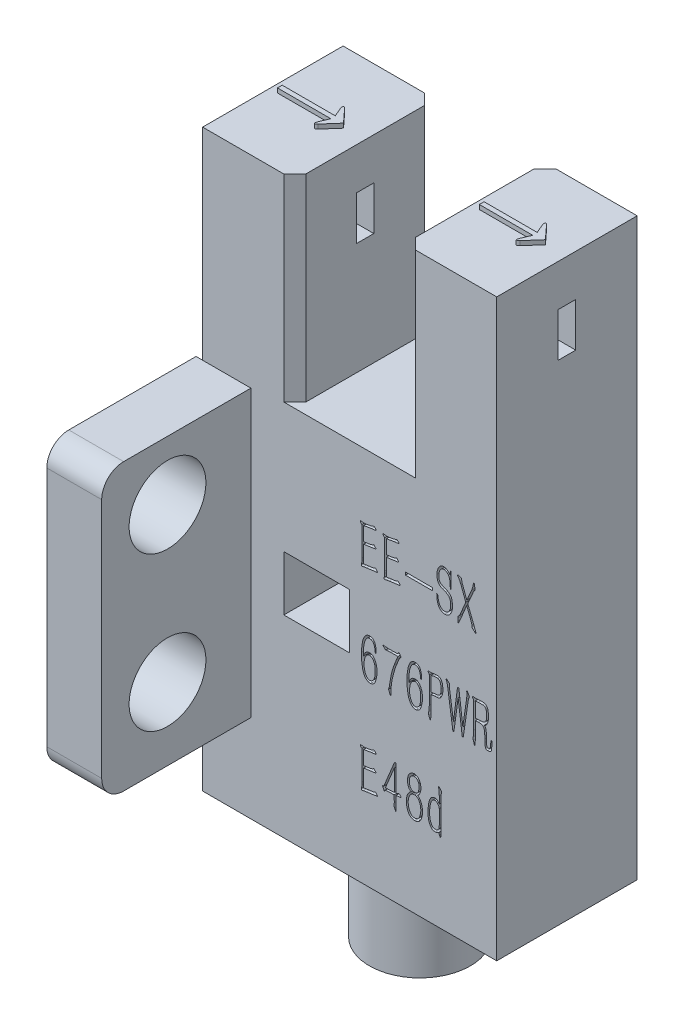
from build123d import *

# Parameters (mm, degrees)
SKETCH_2_W          = 3
SKETCH_2_H          = 2.5
EXTRUDE_1_DEPTH     = 3.2
SKETCH_4_R          = 1.75
EXTRUDE_2_DEPTH     = 2.5
SKETCH_4_6_W        = 0.8
SKETCH_4_6_H        = 2
CUT_EXTRUDE_2_DEPTH = 22.431285542
EXTRUDE_3_DEPTH     = 0.2
CHAMFER_1_SIZE      = 0.5
SKETCH_6_R          = 2.3
EXTRUDE_4_DEPTH     = 4
SKETCH_7_W          = 1.236735563
SKETCH_7_H          = 0.124014489
CUT_EXTRUDE_3_DEPTH = 1


with BuildPart() as part:
    # 草图2 → 凸台-拉伸1 (new, symmetric)
    with BuildSketch(Plane.XY):
        Polygon((-6.7, -13.1), (6.7, -13.1), (6.7, 13.1), (2.5, 13.1), (2.5, 4.1), (-2.5, 4.1), (-2.5, 13.1), (-6.7, 13.1), align=None)
        with Locations((-1.5, -3.05)):
            Rectangle(SKETCH_2_W, SKETCH_2_H, mode=Mode.SUBTRACT)
    extrude(amount=EXTRUDE_1_DEPTH, both=True)

    # 草图4 → 凸台-拉伸2 (add)
    with BuildSketch(Plane.ZY.offset(7)):
        with BuildLine():
            Line((3.2, 3.9), (3.2, -9.1))
            Line((3.2, -9.1), (9, -9.1))
            ThreePointArc((9, -9.1), (9.707106781, -8.807106781), (10, -8.1))
            Line((10, -8.1), (10, 2.9))
            ThreePointArc((10, 2.9), (9.707106781, 3.607106781), (9, 3.9))
            Line((9, 3.9), (3.2, 3.9))
        make_face()
        with Locations((7, -5.8)):
            Circle(SKETCH_4_R, mode=Mode.SUBTRACT)
        with Locations((7, 1.2)):
            Circle(SKETCH_4_R, mode=Mode.SUBTRACT)
    extrude(amount=-EXTRUDE_2_DEPTH)

    # 草图4<6> → 切除-拉伸2 (cut, through all)
    with BuildSketch(Plane.ZY.offset(7)):
        with Locations((0, 10.2)):
            Rectangle(SKETCH_4_6_W, SKETCH_4_6_H)
    extrude(amount=-CUT_EXTRUDE_2_DEPTH, mode=Mode.SUBTRACT)

    # 草图5 → 凸台-拉伸3 (add)
    with BuildSketch(Plane(origin=(0, 13.1, 0), x_dir=(1, 0, 0), z_dir=(0, 1, 0))):
        with BuildLine():
            Line((-6.342765821, -0.149457618), (-6.342765821, 0.066821947))
            Line((-6.342765821, 0.066821947), (-3.921180482, 0.066821947))
            Line((-3.921180482, 0.066821947), (-4.087492009, 0.449413041))
            add(Edge.make_bspline(
                [(-4.087492009, 0.449413041), (-4.093661501, 0.464911568), (-4.10594745, 0.495775392), (-4.115864236, 0.542844481), (-4.118724974, 0.582687002), (-4.114711446, 0.615151707), (-4.091180661, 0.631284598), (-4.063437052, 0.61994992), (-4.034917117, 0.602665346), (-4.016617094, 0.584860648), (-4.006946516, 0.575451822)],
                knots=[0, 0, 0, 0, 1.361127672, 2.710554672, 3.889238455, 4.667095942, 5.224377679, 5.933251688, 6.907834593, 8, 8, 8, 8], degree=3))
            Line((-4.006946516, 0.575451822), (-3.447602813, -0.033859919))
            Line((-3.447602813, -0.033859919), (-3.991284892, -0.652866951))
            add(Edge.make_bspline(
                [(-3.991284892, -0.652866951), (-4.001773822, -0.66333375), (-4.022525279, -0.684041426), (-4.054084164, -0.701704514), (-4.07849851, -0.708759061), (-4.092795662, -0.71125545), (-4.104062491, -0.708377071), (-4.111216416, -0.70025617), (-4.112565935, -0.687632686), (-4.111458101, -0.671706754), (-4.10837618, -0.650917759), (-4.100627557, -0.619793816), (-4.090095486, -0.584471945), (-4.08084722, -0.557880136), (-4.077050927, -0.546964543)],
                knots=[0, 0, 0, 0, 1.783110913, 3.527733803, 4.277390177, 4.850276774, 5.258133937, 5.619216263, 6.077917761, 6.738296525, 7.556762003, 8.604136862, 10.606042242, 12, 12, 12, 12], degree=3))
            Line((-4.077050927, -0.546964543), (-3.910739399, -0.149457618))
            Line((-3.910739399, -0.149457618), (-6.342765821, -0.149457618))
        make_face()
        with BuildLine():
            Line((2.857234179, -0.149457618), (2.857234179, 0.066821947))
            Line((2.857234179, 0.066821947), (5.278819518, 0.066821947))
            Line((5.278819518, 0.066821947), (5.112507991, 0.449413041))
            add(Edge.make_bspline(
                [(5.112507991, 0.449413041), (5.106338499, 0.464911568), (5.09405255, 0.495775392), (5.084135764, 0.542844481), (5.081275026, 0.582687002), (5.085288554, 0.615151707), (5.108819339, 0.631284598), (5.136562948, 0.61994992), (5.165082883, 0.602665346), (5.183382906, 0.584860648), (5.193053484, 0.575451822)],
                knots=[0, 0, 0, 0, 1.361127672, 2.710554672, 3.889238455, 4.667095942, 5.224377679, 5.933251688, 6.907834593, 8, 8, 8, 8], degree=3))
            Line((5.193053484, 0.575451822), (5.752397187, -0.033859919))
            Line((5.752397187, -0.033859919), (5.208715108, -0.652866951))
            add(Edge.make_bspline(
                [(5.208715108, -0.652866951), (5.198226178, -0.66333375), (5.177474721, -0.684041426), (5.145915836, -0.701704514), (5.12150149, -0.708759061), (5.107204338, -0.71125545), (5.095937509, -0.708377071), (5.088783584, -0.70025617), (5.087434065, -0.687632686), (5.088541899, -0.671706754), (5.09162382, -0.650917759), (5.099372443, -0.619793816), (5.109904514, -0.584471945), (5.11915278, -0.557880136), (5.122949073, -0.546964543)],
                knots=[0, 0, 0, 0, 1.783110913, 3.527733803, 4.277390177, 4.850276774, 5.258133937, 5.619216263, 6.077917761, 6.738296525, 7.556762003, 8.604136862, 10.606042242, 12, 12, 12, 12], degree=3))
            Line((5.122949073, -0.546964543), (5.289260601, -0.149457618))
            Line((5.289260601, -0.149457618), (2.857234179, -0.149457618))
        make_face()
    extrude(amount=EXTRUDE_3_DEPTH)

    # 倒角1
    chamfer_1_edges = [part.edges().sort_by_distance(p)[0] for p in [
        (2.5, 8.6, 3.2),
        (2.5, 8.6, -3.2),
        (-2.5, 8.6, -3.2),
        (-2.5, 8.6, 3.2),
    ]]
    chamfer(chamfer_1_edges, length=CHAMFER_1_SIZE)

    # 草图6 → 凸台-拉伸4 (add)
    with BuildSketch(Plane.XZ.offset(13.1)):
        Circle(SKETCH_6_R)
    extrude(amount=EXTRUDE_4_DEPTH)

    # 草图7 → 切除-拉伸3 (cut)
    # profile 1 of 15: a face of its own
    with BuildSketch(Plane.XY.offset(3.2)):
        with BuildLine():
            Line((0.638253384, 1.045754093), (0.638253384, 0.412896645))
            Line((0.638253384, 0.412896645), (0.879889864, 0.444432976))
            add(Edge.make_bspline(
                [(0.879889864, 0.444432976), (0.888560892, 0.445818915), (0.907796449, 0.44889344), (0.937553433, 0.45446439), (0.96726282, 0.461291533), (0.993932582, 0.468474026), (1.016804967, 0.476658085), (1.037672863, 0.48441698), (1.056498915, 0.493471822), (1.067352754, 0.501248413), (1.072517181, 0.504948638)],
                knots=[0, 0, 0, 0, 1.0349619, 2.295929578, 3.567192849, 4.627442236, 5.548769194, 6.428698295, 7.252349857, 8, 8, 8, 8], degree=3))
            Line((1.072517181, 0.504948638), (1.098513346, 0.519438303))
            Line((1.098513346, 0.519438303), (1.182042005, 0.435909644))
            add(Edge.make_bspline(
                [(1.182042005, 0.435909644), (1.185891119, 0.431071637), (1.192287735, 0.423031637), (1.195876921, 0.409568273), (1.19280613, 0.39934632), (1.186771437, 0.392017688), (1.177861515, 0.387300463), (1.171166147, 0.387040692), (1.16755234, 0.386900481)],
                knots=[0, 0, 0, 0, 1.598367029, 2.656232682, 3.46306406, 4.276633186, 5.069817383, 6, 6, 6, 6], degree=3))
            Line((1.16755234, 0.386900481), (0.638253384, 0.312321321))
            Line((0.638253384, 0.312321321), (0.638253384, -0.467137448))
            Line((0.638253384, -0.467137448), (1.066977015, -0.407047953))
            add(Edge.make_bspline(
                [(1.066977015, -0.407047953), (1.073674195, -0.405723623), (1.087206359, -0.403047713), (1.107473017, -0.397165449), (1.127498265, -0.388330613), (1.140738744, -0.381545154), (1.147522508, -0.378068622)],
                knots=[0, 0, 0, 0, 0.952294954, 1.924184826, 2.936455269, 4, 4, 4, 4], degree=3))
            Line((1.147522508, -0.378068622), (1.173092506, -0.363578956))
            Line((1.173092506, -0.363578956), (1.253637999, -0.453073949))
            add(Edge.make_bspline(
                [(1.253637999, -0.453073949), (1.257700952, -0.457842111), (1.264408294, -0.465713652), (1.266176132, -0.479586755), (1.26262259, -0.488386868), (1.258384524, -0.495691329), (1.248520415, -0.498738274), (1.241260567, -0.498958381), (1.236591334, -0.499099945)],
                knots=[0, 0, 0, 0, 1.609002555, 2.656228529, 3.444229916, 4.084037918, 4.767732536, 6, 6, 6, 6], degree=3))
            Line((1.236591334, -0.499099945), (1.193548504, -0.501656945))
            add(Edge.make_bspline(
                [(1.193548504, -0.501656945), (1.181469686, -0.502751638), (1.155438907, -0.505110786), (1.113951465, -0.509808195), (1.067261291, -0.516004912), (1.015502401, -0.522595276), (0.958560558, -0.53087319), (0.896603971, -0.540125624), (0.829468864, -0.551006001), (0.783010477, -0.55835312), (0.758858541, -0.562172607)],
                knots=[0, 0, 0, 0, 0.663087027, 1.429003413, 2.282528104, 3.23817949, 4.281637937, 5.428377517, 6.663111914, 8, 8, 8, 8], degree=3))
            Line((0.758858541, -0.562172607), (0.626746885, -0.585185605))
            add(Edge.make_bspline(
                [(0.626746885, -0.585185605), (0.61645227, -0.589183369), (0.598137325, -0.596295712), (0.572896938, -0.603685066), (0.551289266, -0.602614124), (0.533774587, -0.592026397), (0.525563093, -0.570132269), (0.527576851, -0.554224132), (0.52872856, -0.545125941)],
                knots=[0, 0, 0, 0, 1.380317655, 2.455695842, 3.256886563, 4.014496814, 4.864449804, 6, 6, 6, 6], degree=3))
            add(Edge.make_bspline(
                [(0.52872856, -0.545125941), (0.529211196, -0.541837566), (0.530583048, -0.532490638), (0.536890045, -0.51632081), (0.542536057, -0.495135932), (0.548413009, -0.469641099), (0.551898349, -0.437078357), (0.553684153, -0.412449477), (0.554724724, -0.398098454)],
                knots=[0, 0, 0, 0, 0.398372487, 1.132340191, 2.07227747, 3.032898756, 4.271097258, 6, 6, 6, 6], degree=3))
            Line((0.554724724, -0.398098454), (0.554724724, -0.343549125))
            add(Edge.make_bspline(
                [(0.554724724, -0.343549125), (0.555194841, -0.335595908), (0.556059312, -0.320971195), (0.556628374, -0.301065434), (0.557889616, -0.285035043), (0.557763333, -0.27564814), (0.557707891, -0.271526964)],
                knots=[0, 0, 0, 0, 1.325956836, 2.438225671, 3.314326982, 4, 4, 4, 4], degree=3))
            Line((0.557707891, -0.271526964), (0.554724724, 1.045754093))
            add(Edge.make_bspline(
                [(0.554724724, 1.045754093), (0.549090994, 1.052470702), (0.537763946, 1.065974962), (0.520450194, 1.084893025), (0.506651682, 1.103183439), (0.494301622, 1.117774732), (0.487213009, 1.131547718), (0.483264377, 1.144629827), (0.484050009, 1.155916487), (0.482206956, 1.167015574), (0.493734072, 1.175045075), (0.502800489, 1.173397456), (0.508698728, 1.172325582)],
                knots=[0, 0, 0, 0, 1.53483591, 3.085905438, 4.484103556, 5.548538687, 6.41610315, 7.18824125, 7.885014218, 8.432694789, 8.98037536, 10, 10, 10, 10], degree=3))
            Line((0.508698728, 1.172325582), (0.563248057, 1.16380225))
            add(Edge.make_bspline(
                [(0.563248057, 1.16380225), (0.575315175, 1.162146073), (0.596432495, 1.159247783), (0.624260284, 1.156570143), (0.64500146, 1.155462329), (0.656444568, 1.157132255), (0.661266382, 1.157835917)],
                knots=[0, 0, 0, 0, 1.482629705, 2.594585164, 3.407796403, 4, 4, 4, 4], degree=3))
            Line((0.661266382, 1.157835917), (0.669789715, 1.157835917))
            add(Edge.make_bspline(
                [(0.669789715, 1.157835917), (0.680726797, 1.157980352), (0.701325963, 1.158252384), (0.730804997, 1.15860523), (0.757334448, 1.161563961), (0.773939165, 1.165097419), (0.781871539, 1.166785416)],
                knots=[0, 0, 0, 0, 1.164559704, 2.193360016, 3.136935425, 4, 4, 4, 4], degree=3))
            Line((0.781871539, 1.166785416), (0.894379529, 1.186815248))
            add(Edge.make_bspline(
                [(0.894379529, 1.186815248), (0.905468688, 1.188461447), (0.925129293, 1.191380089), (0.952614351, 1.19625168), (0.977928373, 1.202260362), (1.003694931, 1.209858592), (1.029559697, 1.217682907), (1.052809903, 1.226203188), (1.071785165, 1.234672741), (1.082375851, 1.241404251), (1.087006847, 1.244347743)],
                knots=[0, 0, 0, 0, 1.329594741, 2.357314772, 3.309480275, 4.413369338, 5.543056356, 6.5132362, 7.349881783, 8, 8, 8, 8], degree=3))
            Line((1.087006847, 1.244347743), (1.113003011, 1.261394408))
            Line((1.113003011, 1.261394408), (1.196105504, 1.175308749))
            add(Edge.make_bspline(
                [(1.196105504, 1.175308749), (1.199125106, 1.170335483), (1.204048269, 1.162227065), (1.208509137, 1.150461406), (1.206376204, 1.141032104), (1.200634453, 1.134296895), (1.192060774, 1.129749604), (1.185511453, 1.129444421), (1.182042005, 1.129282752)],
                knots=[0, 0, 0, 0, 1.627163788, 2.652929776, 3.381477164, 4.196017905, 5.044355687, 6, 6, 6, 6], degree=3))
            Line((1.182042005, 1.129282752), (1.136016009, 1.12331642))
            add(Edge.make_bspline(
                [(1.136016009, 1.12331642), (1.126070963, 1.122046856), (1.107456668, 1.119670595), (1.081326269, 1.116200729), (1.058867503, 1.113324873), (1.04015689, 1.110590242), (1.025071852, 1.108955602), (1.013705065, 1.107701339), (1.005897282, 1.106798608), (1.001915887, 1.10640885), (1.000495021, 1.106269754)],
                knots=[0, 0, 0, 0, 1.761538881, 3.297099284, 4.631434889, 5.739811667, 6.619076803, 7.297127464, 7.749161238, 8, 8, 8, 8], degree=3))
            Line((1.000495021, 1.106269754), (0.638253384, 1.045754093))
        make_face()
    # profile 2 of 15: a face of its own
    with BuildSketch(Plane.XY.offset(3.2)):
        with BuildLine():
            Line((1.674690631, 1.045754093), (1.674690631, 0.412896645))
            Line((1.674690631, 0.412896645), (1.916327111, 0.444432976))
            add(Edge.make_bspline(
                [(1.916327111, 0.444432976), (1.924998139, 0.445818915), (1.944233696, 0.44889344), (1.97399068, 0.45446439), (2.003700067, 0.461291533), (2.030369829, 0.468474026), (2.053242214, 0.476658085), (2.07411011, 0.48441698), (2.092936162, 0.493471822), (2.103790001, 0.501248413), (2.108954428, 0.504948638)],
                knots=[0, 0, 0, 0, 1.0349619, 2.295929578, 3.567192849, 4.627442236, 5.548769194, 6.428698295, 7.252349857, 8, 8, 8, 8], degree=3))
            Line((2.108954428, 0.504948638), (2.134950593, 0.519438303))
            Line((2.134950593, 0.519438303), (2.218479252, 0.435909644))
            add(Edge.make_bspline(
                [(2.218479252, 0.435909644), (2.222328366, 0.431071637), (2.228724982, 0.423031637), (2.232314168, 0.409568273), (2.229243377, 0.39934632), (2.223208684, 0.392017688), (2.214298762, 0.387300463), (2.207603394, 0.387040692), (2.203989587, 0.386900481)],
                knots=[0, 0, 0, 0, 1.598367029, 2.656232682, 3.46306406, 4.276633186, 5.069817383, 6, 6, 6, 6], degree=3))
            Line((2.203989587, 0.386900481), (1.674690631, 0.312321321))
            Line((1.674690631, 0.312321321), (1.674690631, -0.467137448))
            Line((1.674690631, -0.467137448), (2.103414262, -0.407047953))
            add(Edge.make_bspline(
                [(2.103414262, -0.407047953), (2.110111442, -0.405723623), (2.123643606, -0.403047713), (2.143910264, -0.397165449), (2.163935512, -0.388330613), (2.177175991, -0.381545154), (2.183959755, -0.378068622)],
                knots=[0, 0, 0, 0, 0.952294954, 1.924184826, 2.936455269, 4, 4, 4, 4], degree=3))
            Line((2.183959755, -0.378068622), (2.209529753, -0.363578956))
            Line((2.209529753, -0.363578956), (2.290075246, -0.453073949))
            add(Edge.make_bspline(
                [(2.290075246, -0.453073949), (2.294138199, -0.457842111), (2.300845541, -0.465713652), (2.302613379, -0.479586755), (2.299059837, -0.488386868), (2.294821771, -0.495691329), (2.284957662, -0.498738274), (2.277697814, -0.498958381), (2.273028581, -0.499099945)],
                knots=[0, 0, 0, 0, 1.609002555, 2.656228529, 3.444229916, 4.084037918, 4.767732536, 6, 6, 6, 6], degree=3))
            Line((2.273028581, -0.499099945), (2.229985751, -0.501656945))
            add(Edge.make_bspline(
                [(2.229985751, -0.501656945), (2.217906933, -0.502751638), (2.191876154, -0.505110786), (2.150388712, -0.509808195), (2.103698538, -0.516004912), (2.051939648, -0.522595276), (1.994997805, -0.53087319), (1.933041218, -0.540125624), (1.865906111, -0.551006001), (1.819447724, -0.55835312), (1.795295788, -0.562172607)],
                knots=[0, 0, 0, 0, 0.663087027, 1.429003413, 2.282528104, 3.23817949, 4.281637937, 5.428377517, 6.663111914, 8, 8, 8, 8], degree=3))
            Line((1.795295788, -0.562172607), (1.663184132, -0.585185605))
            add(Edge.make_bspline(
                [(1.663184132, -0.585185605), (1.652889517, -0.589183369), (1.634574572, -0.596295712), (1.609334185, -0.603685066), (1.587726513, -0.602614124), (1.570211834, -0.592026397), (1.56200034, -0.570132269), (1.564014098, -0.554224132), (1.565165807, -0.545125941)],
                knots=[0, 0, 0, 0, 1.380317655, 2.455695842, 3.256886563, 4.014496814, 4.864449804, 6, 6, 6, 6], degree=3))
            add(Edge.make_bspline(
                [(1.565165807, -0.545125941), (1.565648443, -0.541837566), (1.567020295, -0.532490638), (1.573327292, -0.51632081), (1.578973304, -0.495135932), (1.584850256, -0.469641099), (1.588335596, -0.437078357), (1.5901214, -0.412449477), (1.591161971, -0.398098454)],
                knots=[0, 0, 0, 0, 0.398372487, 1.132340191, 2.07227747, 3.032898756, 4.271097258, 6, 6, 6, 6], degree=3))
            Line((1.591161971, -0.398098454), (1.591161971, -0.343549125))
            add(Edge.make_bspline(
                [(1.591161971, -0.343549125), (1.591632088, -0.335595908), (1.592496559, -0.320971195), (1.593065621, -0.301065434), (1.594326863, -0.285035043), (1.59420058, -0.27564814), (1.594145138, -0.271526964)],
                knots=[0, 0, 0, 0, 1.325956836, 2.438225671, 3.314326982, 4, 4, 4, 4], degree=3))
            Line((1.594145138, -0.271526964), (1.591161971, 1.045754093))
            add(Edge.make_bspline(
                [(1.591161971, 1.045754093), (1.585528241, 1.052470702), (1.574201193, 1.065974962), (1.556887441, 1.084893025), (1.543088929, 1.103183439), (1.530738869, 1.117774732), (1.523650256, 1.131547718), (1.519701624, 1.144629827), (1.520487256, 1.155916487), (1.518644203, 1.167015574), (1.530171319, 1.175045075), (1.539237735, 1.173397456), (1.545135975, 1.172325582)],
                knots=[0, 0, 0, 0, 1.53483591, 3.085905438, 4.484103556, 5.548538687, 6.41610315, 7.18824125, 7.885014218, 8.432694789, 8.98037536, 10, 10, 10, 10], degree=3))
            Line((1.545135975, 1.172325582), (1.599685304, 1.16380225))
            add(Edge.make_bspline(
                [(1.599685304, 1.16380225), (1.611752422, 1.162146073), (1.632869742, 1.159247783), (1.660697531, 1.156570143), (1.681438707, 1.155462329), (1.692881815, 1.157132255), (1.697703629, 1.157835917)],
                knots=[0, 0, 0, 0, 1.482629705, 2.594585164, 3.407796403, 4, 4, 4, 4], degree=3))
            Line((1.697703629, 1.157835917), (1.706226962, 1.157835917))
            add(Edge.make_bspline(
                [(1.706226962, 1.157835917), (1.717164044, 1.157980352), (1.73776321, 1.158252384), (1.767242244, 1.15860523), (1.793771695, 1.161563961), (1.810376412, 1.165097419), (1.818308786, 1.166785416)],
                knots=[0, 0, 0, 0, 1.164559704, 2.193360016, 3.136935425, 4, 4, 4, 4], degree=3))
            Line((1.818308786, 1.166785416), (1.930816776, 1.186815248))
            add(Edge.make_bspline(
                [(1.930816776, 1.186815248), (1.941905935, 1.188461447), (1.96156654, 1.191380089), (1.989051598, 1.19625168), (2.01436562, 1.202260362), (2.040132178, 1.209858592), (2.065996944, 1.217682907), (2.08924715, 1.226203188), (2.108222412, 1.234672741), (2.118813098, 1.241404251), (2.123444094, 1.244347743)],
                knots=[0, 0, 0, 0, 1.329594741, 2.357314772, 3.309480275, 4.413369338, 5.543056356, 6.5132362, 7.349881783, 8, 8, 8, 8], degree=3))
            Line((2.123444094, 1.244347743), (2.149440258, 1.261394408))
            Line((2.149440258, 1.261394408), (2.232542751, 1.175308749))
            add(Edge.make_bspline(
                [(2.232542751, 1.175308749), (2.235562353, 1.170335483), (2.240485516, 1.162227065), (2.244946384, 1.150461406), (2.242813451, 1.141032104), (2.2370717, 1.134296895), (2.228498021, 1.129749604), (2.2219487, 1.129444421), (2.218479252, 1.129282752)],
                knots=[0, 0, 0, 0, 1.627163788, 2.652929776, 3.381477164, 4.196017905, 5.044355687, 6, 6, 6, 6], degree=3))
            Line((2.218479252, 1.129282752), (2.172453256, 1.12331642))
            add(Edge.make_bspline(
                [(2.172453256, 1.12331642), (2.16250821, 1.122046856), (2.143893915, 1.119670595), (2.117763516, 1.116200729), (2.09530475, 1.113324873), (2.076594137, 1.110590242), (2.061509099, 1.108955602), (2.050142312, 1.107701339), (2.042334529, 1.106798608), (2.038353134, 1.10640885), (2.036932268, 1.106269754)],
                knots=[0, 0, 0, 0, 1.761538881, 3.297099284, 4.631434889, 5.739811667, 6.619076803, 7.297127464, 7.749161238, 8, 8, 8, 8], degree=3))
            Line((2.036932268, 1.106269754), (1.674690631, 1.045754093))
        make_face()
    # profile 3 of 15: a face of its own
    with BuildSketch(Plane.XY.offset(3.2)):
        with Locations((3.159881341, 0.103712755)):
            Rectangle(SKETCH_7_W, SKETCH_7_H)
    # profile 4 of 15: a face of its own
    with BuildSketch(Plane.XY.offset(3.2)):
        with BuildLine():
            Line((4.564952724, 1.057260592), (4.593932054, 1.232841244))
            Line((4.593932054, 1.232841244), (4.622485219, 1.229858077))
            Line((4.622485219, 1.229858077), (4.622485219, 0.510914971))
            Line((4.622485219, 0.510914971), (4.587965722, 0.507931804))
            Line((4.587965722, 0.507931804), (4.56793589, 0.812640945))
            add(Edge.make_bspline(
                [(4.56793589, 0.812640945), (4.565298679, 0.829585056), (4.560423712, 0.860906776), (4.550867742, 0.903323421), (4.54200456, 0.938034447), (4.528270627, 0.973210966), (4.50789023, 1.010766472), (4.47787, 1.051020066), (4.44185111, 1.087280334), (4.399136931, 1.11580397), (4.352840897, 1.137604144), (4.319555976, 1.141747271), (4.303286412, 1.143772418)],
                knots=[0, 0, 0, 0, 1.116474761, 2.063838624, 2.831507158, 3.446633667, 4.518832044, 5.603216916, 6.708904972, 7.82779241, 8.938231816, 10, 10, 10, 10], degree=3))
            add(Edge.make_bspline(
                [(4.303286412, 1.143772418), (4.293593112, 1.143356926), (4.273691631, 1.142503873), (4.248709831, 1.136628462), (4.227419303, 1.128836213), (4.209811946, 1.118811252), (4.190445344, 1.105384674), (4.170214371, 1.088716826), (4.149871843, 1.069671151), (4.131829943, 1.04753719), (4.115991558, 1.023299545), (4.099007766, 0.988362347), (4.082095652, 0.943832781), (4.070915573, 0.897711993), (4.066028746, 0.859157624), (4.06302702, 0.826607037), (4.061099456, 0.790073219), (4.059408358, 0.750569864), (4.060861723, 0.709871775), (4.066725983, 0.670072706), (4.077283909, 0.632206571), (4.087912886, 0.608675267), (4.093186263, 0.59700063)],
                knots=[0, 0, 0, 0, 0.864038106, 1.773971445, 2.275285977, 2.88209936, 3.574564674, 4.376127188, 5.218616224, 6.055847121, 6.916999662, 7.795414815, 9.515900782, 11.157236165, 12.013901558, 12.981067707, 14.072720019, 15.277182195, 16.507433409, 17.699229733, 18.858513907, 20, 20, 20, 20], degree=3))
            add(Edge.make_bspline(
                [(4.093186263, 0.59700063), (4.099156814, 0.586174557), (4.110800301, 0.565062057), (4.13257637, 0.536953917), (4.158150281, 0.514172956), (4.194071759, 0.490963054), (4.237160354, 0.47021949), (4.271124077, 0.456503608), (4.286239747, 0.450399309)],
                knots=[0, 0, 0, 0, 0.892298636, 1.740118821, 2.553971753, 3.353728668, 4.822268012, 6, 6, 6, 6], degree=3))
            Line((4.286239747, 0.450399309), (4.386815072, 0.409913479))
            add(Edge.make_bspline(
                [(4.386815072, 0.409913479), (4.399223535, 0.404190911), (4.42311524, 0.393172472), (4.456788396, 0.375643686), (4.487274873, 0.358310042), (4.522352478, 0.334832614), (4.561003811, 0.303997686), (4.599195589, 0.26147193), (4.63023002, 0.213278195), (4.649696743, 0.157084982), (4.665028968, 0.096124749), (4.675381446, 0.029900168), (4.682216504, -0.04240021), (4.684963786, -0.119752534), (4.683747081, -0.199686656), (4.673529124, -0.251867801), (4.668511215, -0.277493297)],
                knots=[0, 0, 0, 0, 0.703245545, 1.354054533, 1.953549274, 2.507188807, 3.525842386, 4.488918984, 5.43838142, 6.454223102, 7.53246407, 8.673253088, 9.899948524, 11.268249991, 12.658472344, 14, 14, 14, 14], degree=3))
            add(Edge.make_bspline(
                [(4.668511215, -0.277493297), (4.662237263, -0.303192376), (4.650084998, -0.352969932), (4.623793258, -0.410160584), (4.600746858, -0.450602174), (4.583673555, -0.476811205), (4.566601324, -0.499334318), (4.544289119, -0.525766646), (4.509877423, -0.553630025), (4.469729403, -0.57581784), (4.432773317, -0.589612445), (4.402098434, -0.597498909), (4.369163308, -0.6014963), (4.346480266, -0.602263928), (4.334822743, -0.602658437)],
                knots=[0, 0, 0, 0, 1.868422262, 3.619020558, 4.429541533, 5.162879566, 5.830420081, 6.429075538, 7.606854402, 8.938752151, 9.657684361, 10.394048182, 11.174651193, 12, 12, 12, 12], degree=3))
            add(Edge.make_bspline(
                [(4.334822743, -0.602658437), (4.321731913, -0.60257516), (4.296109114, -0.602412161), (4.258621248, -0.596348822), (4.223245228, -0.585251349), (4.190302375, -0.568750851), (4.159492365, -0.548141696), (4.130877866, -0.523694583), (4.104413876, -0.495667491), (4.079424116, -0.464602578), (4.057535083, -0.429524804), (4.03775615, -0.391374346), (4.020838626, -0.349954999), (4.001871464, -0.291498422), (3.985204416, -0.21723786), (3.980437176, -0.157115823), (3.978121272, -0.127908809)],
                knots=[0, 0, 0, 0, 0.833862414, 1.63212638, 2.411403016, 3.189256699, 3.973153178, 4.770028097, 5.583768076, 6.428386665, 7.307987397, 8.215552436, 9.166047206, 10.157242313, 12.13320567, 14, 14, 14, 14], degree=3))
            Line((3.978121272, -0.127908809), (3.966614773, 0.024658844))
            Line((3.966614773, 0.024658844), (4.007100603, 0.024658844))
            add(Edge.make_bspline(
                [(4.007100603, 0.024658844), (4.009429474, 0.006605591), (4.013909891, -0.028126314), (4.021782324, -0.078227589), (4.029370356, -0.124411276), (4.039070021, -0.179604965), (4.054244173, -0.241952313), (4.078149466, -0.309708825), (4.109366145, -0.369170656), (4.142717613, -0.410940815), (4.171398795, -0.44000091), (4.194263844, -0.456684904), (4.216537256, -0.471097528), (4.24672416, -0.483424691), (4.284337055, -0.493274207), (4.314588898, -0.493179576), (4.329282577, -0.493133612)],
                knots=[0, 0, 0, 0, 1.134650933, 2.182907786, 3.161205505, 4.052250561, 5.675932663, 7.155002512, 8.52184542, 9.839854562, 10.472309825, 11.060302883, 11.600982628, 12.120735338, 13.087218943, 14, 14, 14, 14], degree=3))
            add(Edge.make_bspline(
                [(4.329282577, -0.493133612), (4.342252247, -0.492670025), (4.367131527, -0.491780742), (4.402710273, -0.484229197), (4.435120394, -0.472656547), (4.46367731, -0.454893948), (4.489287476, -0.433453647), (4.512396064, -0.408377107), (4.533575092, -0.380132584), (4.551236375, -0.348423765), (4.566828355, -0.315646819), (4.579643298, -0.283069471), (4.589149184, -0.251261617), (4.595593867, -0.219862768), (4.599964995, -0.187392963), (4.602192547, -0.152801548), (4.603817065, -0.115271817), (4.602922334, -0.089412218), (4.602455387, -0.07591648)],
                knots=[0, 0, 0, 0, 1.108065456, 2.12556444, 3.098260599, 4.035950869, 4.98490885, 5.94776606, 6.946521194, 7.996930623, 9.045863326, 10.049925535, 10.987930625, 11.881525266, 12.788809675, 13.787786499, 14.845478855, 16, 16, 16, 16], degree=3))
            add(Edge.make_bspline(
                [(4.602455387, -0.07591648), (4.600963401, -0.054852672), (4.598178721, -0.01553867), (4.589148654, 0.038570748), (4.578125596, 0.084020347), (4.563416234, 0.121378148), (4.545545748, 0.152264035), (4.526764421, 0.180025383), (4.505595751, 0.204779832), (4.481476296, 0.226343951), (4.454978001, 0.246334198), (4.425142234, 0.264923667), (4.391724865, 0.282582261), (4.367725388, 0.292623863), (4.355278741, 0.297831655)],
                knots=[0, 0, 0, 0, 1.578487453, 2.946127177, 4.097996722, 5.070650713, 5.936469873, 6.761635482, 7.575228913, 8.364955199, 9.176673428, 10.055112166, 10.991339211, 12, 12, 12, 12], degree=3))
            Line((4.355278741, 0.297831655), (4.231264251, 0.343857651))
            add(Edge.make_bspline(
                [(4.231264251, 0.343857651), (4.21196655, 0.352293386), (4.173726487, 0.369009523), (4.121532041, 0.402817709), (4.076051605, 0.443744269), (4.039427426, 0.493423203), (4.011303067, 0.551265022), (3.994120747, 0.605455329), (3.984550382, 0.654141218), (3.98029235, 0.69564016), (3.977495075, 0.741291531), (3.977905894, 0.77300283), (3.978121272, 0.789627947)],
                knots=[0, 0, 0, 0, 1.141640751, 2.262259852, 3.359181592, 4.444772656, 5.58953336, 6.835542724, 7.519006772, 8.279340868, 9.097919025, 10, 10, 10, 10], degree=3))
            add(Edge.make_bspline(
                [(3.978121272, 0.789627947), (3.978242725, 0.803980773), (3.978477503, 0.831726035), (3.981461426, 0.871864467), (3.986531581, 0.908857447), (3.995616161, 0.95401947), (4.011872541, 1.007056283), (4.037125324, 1.066430142), (4.066388598, 1.119463772), (4.100030276, 1.16393633), (4.138438499, 1.198707644), (4.173406652, 1.222779031), (4.205172333, 1.237075615), (4.232410869, 1.244805649), (4.26268618, 1.248741634), (4.283815051, 1.249496679), (4.294763079, 1.249887909)],
                knots=[0, 0, 0, 0, 0.971164436, 1.877345498, 2.721647718, 3.496542433, 4.992871533, 6.466013358, 7.856401207, 9.083219229, 10.219456221, 11.349985082, 11.939558551, 12.569451447, 13.258754286, 14, 14, 14, 14], degree=3))
            add(Edge.make_bspline(
                [(4.294763079, 1.249887909), (4.307034045, 1.248491995), (4.331439324, 1.245715713), (4.367236032, 1.236013893), (4.401865222, 1.22208374), (4.434205773, 1.203173322), (4.463949038, 1.18211704), (4.49071157, 1.160261574), (4.512585116, 1.136614355), (4.524622394, 1.119885533), (4.530433226, 1.111809921)],
                knots=[0, 0, 0, 0, 1.049956055, 2.088219507, 3.145806661, 4.218152357, 5.268178035, 6.24663062, 7.15358473, 8, 8, 8, 8], degree=3))
            Line((4.530433226, 1.111809921), (4.564952724, 1.057260592))
        make_face()
    # profile 5 of 15: a face of its own
    with BuildSketch(Plane.XY.offset(3.2)):
        with BuildLine():
            Line((5.337166659, 0.450399309), (5.555790141, 0.9537021))
            add(Edge.make_bspline(
                [(5.555790141, 0.9537021), (5.558386562, 0.960221685), (5.564108605, 0.974589671), (5.572590889, 0.9986246), (5.581903502, 1.027062698), (5.59148119, 1.058571302), (5.601635108, 1.089776165), (5.609307686, 1.118254101), (5.616356157, 1.14172981), (5.623278591, 1.166886891), (5.629745833, 1.195637375), (5.632151179, 1.218459934), (5.633352468, 1.229858077)],
                knots=[0, 0, 0, 0, 0.732180493, 1.613593324, 2.658872914, 3.854365511, 5.049858108, 6.082130019, 6.931166509, 7.607179292, 8.804966943, 10, 10, 10, 10], degree=3))
            Line((5.633352468, 1.229858077), (5.639318801, 1.27886724))
            Line((5.639318801, 1.27886724), (5.673838298, 1.284407406))
            Line((5.673838298, 1.284407406), (5.719864294, 1.042770926))
            add(Edge.make_bspline(
                [(5.719864294, 1.042770926), (5.713666441, 1.036605581), (5.702540486, 1.025537982), (5.687911663, 1.00858642), (5.674591154, 0.991146572), (5.661638531, 0.974821901), (5.6501023, 0.955222527), (5.638894509, 0.932231228), (5.625212557, 0.901198459), (5.61566735, 0.87773176), (5.61033947, 0.864633274)],
                knots=[0, 0, 0, 0, 0.993153163, 1.782839525, 2.541730564, 3.487713786, 4.146615727, 5.1212284, 6.393146485, 8, 8, 8, 8], degree=3))
            Line((5.61033947, 0.864633274), (5.377226323, 0.338317485))
            Line((5.377226323, 0.338317485), (5.667871965, -0.398098454))
            Line((5.667871965, -0.398098454), (5.72540446, -0.547682941))
            add(Edge.make_bspline(
                [(5.72540446, -0.547682941), (5.73128151, -0.560728946), (5.741798095, -0.584073896), (5.748709839, -0.613202721), (5.751622628, -0.631881872), (5.75160747, -0.641584747), (5.75085839, -0.648773641), (5.746739431, -0.654070921), (5.740496168, -0.655843936), (5.73312068, -0.660708137), (5.721742255, -0.652066455), (5.710739754, -0.640375267), (5.699855869, -0.626772282), (5.693025354, -0.619119873), (5.690884963, -0.616721935)],
                knots=[0, 0, 0, 0, 2.761412339, 4.941361911, 5.773257577, 6.405449525, 6.825913753, 7.139309286, 7.63100465, 8.075064367, 8.689683572, 10.011329248, 11.37683553, 12, 12, 12, 12], degree=3))
            Line((5.690884963, -0.616721935), (5.618862802, -0.553649274))
            add(Edge.make_bspline(
                [(5.618862802, -0.553649274), (5.612969895, -0.54905189), (5.602557906, -0.540928919), (5.589965832, -0.529366938), (5.581577884, -0.521536681), (5.575466422, -0.513692539), (5.577329573, -0.500812052), (5.576839612, -0.482476509), (5.578055489, -0.456564921), (5.57468944, -0.437545726), (5.572836806, -0.427077785)],
                knots=[0, 0, 0, 0, 1.23478745, 2.181706523, 2.812113369, 3.150477244, 3.760922406, 4.816942161, 6.248082283, 8, 8, 8, 8], degree=3))
            add(Edge.make_bspline(
                [(5.572836806, -0.427077785), (5.571148336, -0.417415024), (5.568040349, -0.399628672), (5.563893446, -0.377129066), (5.559264238, -0.357247452), (5.551986606, -0.336712513), (5.542774722, -0.309197783), (5.531028787, -0.277507622), (5.519618402, -0.245989569), (5.510087401, -0.219286607), (5.503453589, -0.199902102), (5.499685862, -0.189416164), (5.498257646, -0.185441305)],
                knots=[0, 0, 0, 0, 1.161118987, 2.137284709, 2.708267813, 3.575038829, 4.713036419, 6.143931784, 7.57482715, 8.681074464, 9.500040603, 10, 10, 10, 10], degree=3))
            Line((5.498257646, -0.185441305), (5.331200326, 0.237315993))
            Line((5.331200326, 0.237315993), (5.055044349, -0.427077785))
            Line((5.055044349, -0.427077785), (4.986005355, -0.585185605))
            add(Edge.make_bspline(
                [(4.986005355, -0.585185605), (4.980635526, -0.596473703), (4.970936959, -0.616861384), (4.957696593, -0.639863063), (4.946721772, -0.65177208), (4.942248648, -0.657702999), (4.935905127, -0.659026271), (4.934931757, -0.655837993), (4.934439193, -0.654224599)],
                knots=[0, 0, 0, 0, 2.381178734, 4.300699059, 5.010137615, 5.450112729, 5.721735305, 6, 6, 6, 6], degree=3))
            add(Edge.make_bspline(
                [(4.934439193, -0.654224599), (4.933364912, -0.653433773), (4.9301484, -0.651065955), (4.928062823, -0.643211128), (4.926245975, -0.633170286), (4.92717379, -0.622670784), (4.927704167, -0.612043441), (4.928069558, -0.600384256), (4.928612275, -0.585332415), (4.928522398, -0.574248296), (4.92847286, -0.568138939)],
                knots=[0, 0, 0, 0, 0.356334141, 1.066903249, 2.083622437, 3.166508591, 3.901872409, 4.984758563, 6.338055839, 8, 8, 8, 8], degree=3))
            Line((4.92847286, -0.568138939), (4.934439193, -0.453073949))
            add(Edge.make_bspline(
                [(4.934439193, -0.453073949), (4.934899191, -0.443974217), (4.93570538, -0.428026123), (4.938060285, -0.407299705), (4.939674804, -0.392837453), (4.943178042, -0.380349899), (4.953548267, -0.368408036), (4.967445786, -0.35346195), (4.982403637, -0.338011872), (4.994801421, -0.322453298), (5.004964784, -0.30613358), (5.015108974, -0.291022297), (5.025119449, -0.274777355), (5.033760062, -0.255969972), (5.044812406, -0.232021734), (5.056802552, -0.204072122), (5.068860564, -0.175939643), (5.07960634, -0.150834122), (5.087887014, -0.130355552), (5.093227986, -0.118520548), (5.095530179, -0.113419144)],
                knots=[0, 0, 0, 0, 1.283891209, 2.250134334, 2.938194825, 3.337125035, 4.054003749, 5.116665614, 6.235914532, 7.077065651, 7.915591523, 8.942962049, 9.643436631, 10.601555545, 11.855913542, 13.362341093, 14.887150874, 16.17010505, 17.211235183, 18, 18, 18, 18], degree=3))
            Line((5.095530179, -0.113419144), (5.288157497, 0.343857651))
            Line((5.288157497, 0.343857651), (5.069534015, 0.939212435))
            add(Edge.make_bspline(
                [(5.069534015, 0.939212435), (5.062286244, 0.955121126), (5.04655265, 0.989656003), (5.026577528, 1.033644538), (5.009744485, 1.069408722), (4.99846568, 1.093122317), (4.98778983, 1.111977909), (4.974838225, 1.131688953), (4.958746083, 1.154956799), (4.94646396, 1.173854598), (4.939979359, 1.183832081)],
                knots=[0, 0, 0, 0, 1.512108789, 3.282513405, 4.178459187, 4.931286787, 5.553090324, 6.050678811, 6.970815613, 8, 8, 8, 8], degree=3))
            Line((4.939979359, 1.183832081), (4.914409361, 1.218351578))
            Line((4.914409361, 1.218351578), (4.92847286, 1.261394408))
            Line((4.92847286, 1.261394408), (5.098513346, 1.201304913))
            add(Edge.make_bspline(
                [(5.098513346, 1.201304913), (5.099271388, 1.189944201), (5.100654743, 1.169211988), (5.101978883, 1.138861786), (5.105939236, 1.107400411), (5.111217829, 1.077804658), (5.118225978, 1.049140024), (5.126140601, 1.023243267), (5.135292274, 0.993656632), (5.143003282, 0.973124198), (5.147096342, 0.962225433)],
                knots=[0, 0, 0, 0, 1.113815777, 2.032607081, 2.970224408, 4.213083212, 4.971379877, 5.85514338, 6.861494526, 8, 8, 8, 8], degree=3))
            Line((5.147096342, 0.962225433), (5.337166659, 0.450399309))
        make_face()
    # profile 6 of 15: a face of its own
    with BuildSketch(Plane.XY.offset(3.2)):
        with BuildLine():
            Line((1.207612003, -3.717829969), (1.16755234, -3.717829969))
            add(Edge.make_bspline(
                [(1.16755234, -3.717829969), (1.164814296, -3.70066423), (1.159396927, -3.666700892), (1.154407347, -3.614801656), (1.148322309, -3.56087347), (1.137903637, -3.503812622), (1.121511109, -3.444488827), (1.098453678, -3.397327179), (1.076641327, -3.361988968), (1.058046027, -3.338357341), (1.036712587, -3.318562272), (1.013910738, -3.301897614), (0.989356144, -3.289013556), (0.963612911, -3.279716658), (0.936292172, -3.275557313), (0.908484445, -3.275819318), (0.881409218, -3.278972627), (0.856259915, -3.285530063), (0.83358317, -3.294406957), (0.812533434, -3.306161259), (0.793218391, -3.323158839), (0.773071568, -3.344459701), (0.752861137, -3.372225697), (0.731706596, -3.405021317), (0.711204007, -3.443327199), (0.69311526, -3.486931959), (0.676962239, -3.535226282), (0.658203132, -3.606596539), (0.64080848, -3.702426944), (0.630376319, -3.800472133), (0.625443808, -3.877475642), (0.622995829, -3.929056013), (0.62098863, -3.973798527), (0.620845974, -4.001371056), (0.620780552, -4.014015777)],
                knots=[0, 0, 0, 0, 1.172618578, 2.320089015, 3.517365984, 4.833421129, 6.231766425, 7.655217032, 8.357323983, 9.032478261, 9.676711985, 10.315215253, 10.932648665, 11.54199308, 12.153444918, 12.786093219, 13.413857257, 13.988112725, 14.53457488, 15.054145165, 15.605211832, 16.262994999, 17.029841423, 17.917944275, 18.895673466, 19.956732694, 21.09950916, 22.329492637, 24.933332206, 27.662278065, 28.97833321, 30.139613505, 31.146829503, 32, 32, 32, 32], degree=3))
            Line((0.620780552, -4.014015777), (0.618223552, -4.126097601))
            add(Edge.make_bspline(
                [(0.618223552, -4.126097601), (0.625337506, -4.106024202), (0.63819607, -4.069741273), (0.657939022, -4.019682287), (0.68029432, -3.977234546), (0.706354935, -3.937983361), (0.740079285, -3.901756447), (0.774530552, -3.87528873), (0.806925187, -3.856994063), (0.835692717, -3.84650934), (0.868082967, -3.839266729), (0.890933507, -3.837042959), (0.902902862, -3.835878125)],
                knots=[0, 0, 0, 0, 1.463710204, 2.645675197, 3.693667506, 4.755032446, 5.874045908, 7.078730407, 7.725382873, 8.423483439, 9.174203962, 10, 10, 10, 10], degree=3))
            add(Edge.make_bspline(
                [(0.902902862, -3.835878125), (0.920195004, -3.836539356), (0.953079888, -3.837796835), (1.000422177, -3.851950417), (1.044680034, -3.876786636), (1.078771722, -3.907154593), (1.10629276, -3.937124194), (1.126563679, -3.964567698), (1.146344503, -3.99561018), (1.171770425, -4.042125547), (1.199187956, -4.10556217), (1.218998686, -4.17334827), (1.229289283, -4.230782044), (1.235999371, -4.277076611), (1.239552748, -4.3264842), (1.241623282, -4.395557343), (1.24060849, -4.48176944), (1.235907237, -4.55029116), (1.233608168, -4.583800563)],
                knots=[0, 0, 0, 0, 0.909148716, 1.728949998, 2.576991438, 3.564625719, 4.121218537, 4.72026629, 5.360049571, 6.060456872, 7.512703724, 8.993852322, 9.770776208, 10.587253518, 11.458483217, 12.380006039, 14.229702395, 16, 16, 16, 16], degree=3))
            add(Edge.make_bspline(
                [(1.233608168, -4.583800563), (1.230922427, -4.601159101), (1.225352259, -4.637160324), (1.213549537, -4.692695588), (1.199071213, -4.751684764), (1.182437771, -4.81196489), (1.163178433, -4.869200856), (1.137698542, -4.917976761), (1.106883118, -4.95626916), (1.071277692, -4.982668548), (1.036113879, -5.000064619), (1.00466491, -5.013531781), (0.97729086, -5.023250723), (0.95977981, -5.025553187), (0.951912025, -5.026587693)],
                knots=[0, 0, 0, 0, 1.110217054, 2.302565578, 3.587623031, 4.949459538, 6.256081064, 7.397105523, 8.411240029, 9.334418742, 10.173869837, 10.886090718, 11.499516107, 12, 12, 12, 12], degree=3))
            add(Edge.make_bspline(
                [(0.951912025, -5.026587693), (0.937554244, -5.027791351), (0.908928197, -5.030191163), (0.872773738, -5.023623623), (0.843780512, -5.013502025), (0.820285147, -5.001405945), (0.794174207, -4.986752594), (0.766968257, -4.967617752), (0.739326276, -4.945360949), (0.714591558, -4.917863574), (0.691798583, -4.887166486), (0.665519112, -4.840716219), (0.637880269, -4.779083371), (0.612237896, -4.715091515), (0.59573126, -4.658469079), (0.584539308, -4.607754393), (0.573955563, -4.548888077), (0.564812407, -4.48472164), (0.55674576, -4.421320214), (0.550002882, -4.364470926), (0.544299796, -4.317200179), (0.53911098, -4.266957826), (0.535491203, -4.211107162), (0.53432111, -4.145275863), (0.535441479, -4.075939433), (0.536903618, -4.027935302), (0.537678059, -4.002509278)],
                knots=[0, 0, 0, 0, 0.848219995, 1.691151707, 2.144998995, 2.659153853, 3.249319417, 3.912736756, 4.621867519, 5.340468245, 6.090710837, 6.87657341, 8.487178015, 10.078339935, 10.944022033, 11.968008362, 13.14490399, 14.476453821, 15.796264219, 16.920399402, 17.85823784, 18.608902694, 19.903936842, 21.162934464, 22.497310667, 24, 24, 24, 24], degree=3))
            add(Edge.make_bspline(
                [(0.537678059, -4.002509278), (0.538190851, -3.982193363), (0.539155651, -3.943969627), (0.54133917, -3.890272399), (0.54359468, -3.843921799), (0.548420786, -3.790749338), (0.556371963, -3.725597878), (0.568909653, -3.645870667), (0.583619519, -3.565890673), (0.599655587, -3.501578018), (0.61508651, -3.452355703), (0.629590494, -3.414703667), (0.647819935, -3.376148561), (0.667623846, -3.336465223), (0.690239275, -3.298766244), (0.715143139, -3.264867638), (0.742023677, -3.236247063), (0.770797759, -3.212018706), (0.803277034, -3.193714437), (0.839523247, -3.180779702), (0.880064976, -3.174078407), (0.908278842, -3.174054016), (0.922932694, -3.174041347)],
                knots=[0, 0, 0, 0, 1.211628523, 2.279639787, 3.204225299, 3.977932759, 5.462339825, 7.116605252, 8.789327199, 10.30942825, 11.064792467, 11.863814246, 12.712679163, 13.606614715, 14.50718602, 15.330439464, 16.109367713, 16.843542067, 17.564206182, 18.319665359, 19.127259812, 20, 20, 20, 20], degree=3))
            add(Edge.make_bspline(
                [(0.922932694, -3.174041347), (0.937784806, -3.175270856), (0.965851175, -3.177594286), (1.004536826, -3.188128271), (1.037767755, -3.202115779), (1.064075209, -3.221943496), (1.08472054, -3.243808233), (1.103798008, -3.263668577), (1.118804038, -3.283793267), (1.131855694, -3.303533919), (1.142649382, -3.325451596), (1.153460977, -3.350237139), (1.163461493, -3.379405664), (1.173183024, -3.411304907), (1.182257705, -3.44342409), (1.189986513, -3.47325097), (1.19596985, -3.499542921), (1.202026012, -3.531258503), (1.207045741, -3.572918712), (1.207412444, -3.607149604), (1.207612003, -3.625777976)],
                knots=[0, 0, 0, 0, 1.358046768, 2.566331314, 3.646368544, 4.629682629, 5.546946845, 6.391627168, 7.141431054, 7.835891544, 8.549473584, 9.368770778, 10.304200405, 11.362836174, 12.414134618, 13.351720444, 14.176238426, 14.875889185, 16.299866179, 18, 18, 18, 18], degree=3))
            Line((1.207612003, -3.625777976), (1.207612003, -3.717829969))
        make_face()
        with BuildLine():
            add(Edge.make_bspline(
                [(0.655300049, -4.428249743), (0.656161705, -4.45384867), (0.657930102, -4.506385962), (0.66867552, -4.586066536), (0.687358375, -4.666906145), (0.709684457, -4.733148565), (0.731831866, -4.783779131), (0.751727996, -4.817972308), (0.773298905, -4.849128604), (0.797968781, -4.875882643), (0.825098085, -4.898602438), (0.85644842, -4.912910584), (0.890389801, -4.921341621), (0.91379192, -4.920488178), (0.92591586, -4.920046035)],
                knots=[0, 0, 0, 0, 1.4886747, 3.055242853, 4.666194597, 6.306608966, 7.112592917, 7.87485258, 8.603662743, 9.310999056, 9.986965693, 10.644668568, 11.297843225, 12, 12, 12, 12], degree=3))
            add(Edge.make_bspline(
                [(0.92591586, -4.920046035), (0.936371632, -4.919054946), (0.957328337, -4.917068486), (0.987761073, -4.906128251), (1.017020565, -4.889761525), (1.044480082, -4.867406859), (1.069425689, -4.840999797), (1.091628022, -4.811732192), (1.109570889, -4.779553288), (1.128323926, -4.732234175), (1.145623462, -4.66736947), (1.155138884, -4.583721671), (1.160996832, -4.496212625), (1.165514056, -4.406035444), (1.164491006, -4.312569297), (1.153274824, -4.250157845), (1.147522508, -4.218149594)],
                knots=[0, 0, 0, 0, 0.542441635, 1.087226227, 1.660703064, 2.273516638, 2.914006631, 3.539772715, 4.172601069, 4.816509057, 6.173746714, 7.636628278, 9.17189136, 10.71932084, 12.317475397, 14, 14, 14, 14], degree=3))
            add(Edge.make_bspline(
                [(1.147522508, -4.218149594), (1.139713863, -4.191898127), (1.124198188, -4.139736804), (1.09458437, -4.079056855), (1.067107895, -4.035720366), (1.046797855, -4.007456161), (1.024113562, -3.985673731), (1.001548563, -3.968108861), (0.977966562, -3.955842953), (0.954576632, -3.946316989), (0.930183755, -3.942199839), (0.91399234, -3.942062417), (0.905886028, -3.941993617)],
                knots=[0, 0, 0, 0, 2.076888393, 4.126750173, 5.096135134, 5.973977047, 6.759453719, 7.47553224, 8.136547057, 8.771446398, 9.384918551, 10, 10, 10, 10], degree=3))
            add(Edge.make_bspline(
                [(0.905886028, -3.941993617), (0.89600948, -3.943521607), (0.876122069, -3.946598368), (0.847469217, -3.957096739), (0.820005181, -3.972347316), (0.786730509, -3.998756714), (0.750302539, -4.035707767), (0.722140459, -4.078345424), (0.705557778, -4.115880743), (0.693678192, -4.147989678), (0.68316621, -4.185084324), (0.673400839, -4.226420677), (0.665388593, -4.271941197), (0.659390451, -4.321004895), (0.656103548, -4.373513368), (0.655573286, -4.409636161), (0.655300049, -4.428249743)],
                knots=[0, 0, 0, 0, 0.703513377, 1.416593983, 2.138698186, 2.910269809, 4.405335412, 5.780974721, 6.484987373, 7.296510348, 8.193863016, 9.202460595, 10.29132512, 11.452082192, 12.687092747, 14, 14, 14, 14], degree=3))
        make_face(mode=Mode.SUBTRACT)
    # profile 7 of 15: a face of its own
    with BuildSketch(Plane.XY.offset(3.2)):
        with BuildLine():
            add(Edge.make_bspline(
                [(2.198023254, -3.341098667), (2.177709638, -3.340798243), (2.138788322, -3.340222625), (2.083243269, -3.339657598), (2.033095506, -3.340080026), (1.988632966, -3.339062594), (1.949711328, -3.340007901), (1.916326493, -3.339703168), (1.888474987, -3.340064041), (1.871720634, -3.340782116), (1.864334782, -3.341098667)],
                knots=[0, 0, 0, 0, 1.461051911, 2.799406174, 3.994695385, 5.067439477, 5.997164994, 6.794024468, 7.468367567, 8, 8, 8, 8], degree=3))
            Line((1.864334782, -3.341098667), (1.726256793, -3.346638833))
            add(Edge.make_bspline(
                [(1.726256793, -3.346638833), (1.716104944, -3.346558482), (1.698639463, -3.346420243), (1.681759202, -3.350779667), (1.674690631, -3.352605166)],
                knots=[0, 0, 0, 0, 1.16250452, 2, 2, 2, 2], degree=3))
            Line((1.674690631, -3.352605166), (1.6457113, -3.364111665))
            add(Edge.make_bspline(
                [(1.6457113, -3.364111665), (1.642437584, -3.364824139), (1.636727415, -3.366066869), (1.631076013, -3.364696418), (1.628664635, -3.364111665)],
                knots=[0, 0, 0, 0, 1.146626707, 2, 2, 2, 2], degree=3))
            add(Edge.make_bspline(
                [(1.628664635, -3.364111665), (1.626318227, -3.362934875), (1.620265125, -3.359899074), (1.611699505, -3.350434607), (1.600106639, -3.337580931), (1.592457822, -3.326719137), (1.588178805, -3.320642668)],
                knots=[0, 0, 0, 0, 0.522008364, 1.346640983, 2.515617707, 4, 4, 4, 4], degree=3))
            Line((1.588178805, -3.320642668), (1.52808931, -3.251603674))
            add(Edge.make_bspline(
                [(1.52808931, -3.251603674), (1.525809015, -3.248497951), (1.522318812, -3.243744354), (1.518055226, -3.236441483), (1.521715785, -3.230635783), (1.525614677, -3.229384725), (1.52808931, -3.228590676)],
                knots=[0, 0, 0, 0, 1.576958087, 2.413680609, 2.993160347, 4, 4, 4, 4], degree=3))
            Line((1.52808931, -3.228590676), (1.585621805, -3.234557009))
            Line((1.585621805, -3.234557009), (1.68619713, -3.240097175))
            add(Edge.make_bspline(
                [(1.68619713, -3.240097175), (1.709913, -3.24179245), (1.754901488, -3.245008348), (1.81899255, -3.247544946), (1.875860847, -3.248312602), (1.911357953, -3.246776483), (1.92783361, -3.246063508)],
                knots=[0, 0, 0, 0, 1.17952993, 2.237542501, 3.181971475, 4, 4, 4, 4], degree=3))
            Line((1.92783361, -3.246063508), (2.183959755, -3.240097175))
            Line((2.183959755, -3.240097175), (2.24404925, -3.154011516))
            Line((2.24404925, -3.154011516), (2.345050742, -3.300612837))
            Line((2.345050742, -3.300612837), (2.276011748, -3.364111665))
            add(Edge.make_bspline(
                [(2.276011748, -3.364111665), (2.272935425, -3.371661213), (2.267289791, -3.385516059), (2.258822463, -3.404336337), (2.252752662, -3.420014422), (2.247776899, -3.431460985), (2.2436108, -3.4409583), (2.239357931, -3.4507641), (2.233679901, -3.463834732), (2.226648719, -3.480266694), (2.217482242, -3.499647087), (2.207833584, -3.522569847), (2.196245141, -3.54853061), (2.178991314, -3.58672963), (2.157880347, -3.634878923), (2.135169937, -3.69081277), (2.11401474, -3.742160168), (2.089736889, -3.80647815), (2.06219844, -3.888016958), (2.029982214, -3.991112831), (1.998610642, -4.10406487), (1.966542245, -4.225964074), (1.938001896, -4.355443281), (1.917722643, -4.465894945), (1.904781803, -4.553883515), (1.896460288, -4.6172163), (1.89076919, -4.677804326), (1.885861822, -4.73503545), (1.883007586, -4.788480969), (1.881243247, -4.837496625), (1.880654003, -4.881838872), (1.881437638, -4.909819013), (1.881807614, -4.923029202)],
                knots=[0, 0, 0, 0, 0.452499367, 0.830421745, 1.145244612, 1.385457386, 1.523169464, 1.720933553, 1.978750205, 2.31422616, 2.712964021, 3.168544679, 3.694564508, 4.291044716, 5.495236599, 6.612541028, 7.641936826, 8.577774526, 10.428066285, 12.41833758, 14.572718391, 16.934712686, 19.414194725, 21.930665941, 23.166281125, 24.350715242, 25.475866727, 26.54391973, 27.539008514, 28.446374518, 29.266490973, 30, 30, 30, 30], degree=3))
            Line((1.881807614, -4.923029202), (1.881807614, -5.046617525))
            Line((1.881807614, -5.046617525), (1.861777782, -5.058124024))
            Line((1.861777782, -5.058124024), (1.76972579, -4.853990207))
            add(Edge.make_bspline(
                [(1.76972579, -4.853990207), (1.771489957, -4.848466877), (1.77459649, -4.838740808), (1.777916549, -4.825889027), (1.780171469, -4.817101309), (1.780962415, -4.812512944), (1.781232289, -4.810947378)],
                knots=[0, 0, 0, 0, 1.560097851, 2.74718673, 3.572535822, 4, 4, 4, 4], degree=3))
            Line((1.781232289, -4.810947378), (1.804245287, -4.730401884))
            add(Edge.make_bspline(
                [(1.804245287, -4.730401884), (1.807242399, -4.713357699), (1.8136329, -4.67701575), (1.823506358, -4.619090357), (1.833637852, -4.554130775), (1.844165935, -4.484908199), (1.854969411, -4.416745474), (1.864450442, -4.35515811), (1.873613322, -4.30308223), (1.881567197, -4.257229092), (1.891248185, -4.211291997), (1.904174705, -4.159208601), (1.920510743, -4.097731476), (1.939328633, -4.029149921), (1.960651569, -3.958245856), (1.981555773, -3.889121607), (2.003432753, -3.824891007), (2.018266831, -3.783723456), (2.025425768, -3.763855965)],
                knots=[0, 0, 0, 0, 0.835904569, 1.782332284, 2.838215692, 4.011468279, 5.164379694, 6.171749793, 7.021175418, 7.718362152, 8.4194883, 9.288205322, 10.310099412, 11.492047838, 12.723030323, 13.886349048, 14.979950486, 16, 16, 16, 16], degree=3))
            Line((2.025425768, -3.763855965), (2.12898426, -3.507729819))
            Line((2.12898426, -3.507729819), (2.198023254, -3.341098667))
        make_face()
    # profile 8 of 15: a face of its own
    with BuildSketch(Plane.XY.offset(3.2)):
        with BuildLine():
            Line((3.280486497, -3.717829969), (3.240426834, -3.717829969))
            add(Edge.make_bspline(
                [(3.240426834, -3.717829969), (3.23768879, -3.70066423), (3.232271421, -3.666700892), (3.227281841, -3.614801656), (3.221196803, -3.56087347), (3.210778131, -3.503812622), (3.194385603, -3.444488827), (3.171328172, -3.397327179), (3.149515821, -3.361988968), (3.130920521, -3.338357341), (3.109587081, -3.318562272), (3.086785232, -3.301897614), (3.062230638, -3.289013556), (3.036487405, -3.279716658), (3.009166666, -3.275557313), (2.981358939, -3.275819318), (2.954283712, -3.278972627), (2.929134409, -3.285530063), (2.906457664, -3.294406957), (2.885407928, -3.306161259), (2.866092885, -3.323158839), (2.845946062, -3.344459701), (2.825735631, -3.372225697), (2.80458109, -3.405021317), (2.784078501, -3.443327199), (2.765989754, -3.486931959), (2.749836733, -3.535226282), (2.731077626, -3.606596539), (2.713682974, -3.702426944), (2.703250813, -3.800472133), (2.698318302, -3.877475642), (2.695870323, -3.929056013), (2.693863124, -3.973798527), (2.693720468, -4.001371056), (2.693655046, -4.014015777)],
                knots=[0, 0, 0, 0, 1.172618578, 2.320089015, 3.517365984, 4.833421129, 6.231766425, 7.655217032, 8.357323983, 9.032478261, 9.676711985, 10.315215253, 10.932648665, 11.54199308, 12.153444918, 12.786093219, 13.413857257, 13.988112725, 14.53457488, 15.054145165, 15.605211832, 16.262994999, 17.029841423, 17.917944275, 18.895673466, 19.956732694, 21.09950916, 22.329492637, 24.933332206, 27.662278065, 28.97833321, 30.139613505, 31.146829503, 32, 32, 32, 32], degree=3))
            Line((2.693655046, -4.014015777), (2.691098046, -4.126097601))
            add(Edge.make_bspline(
                [(2.691098046, -4.126097601), (2.698212, -4.106024202), (2.711070564, -4.069741273), (2.730813516, -4.019682287), (2.753168814, -3.977234546), (2.779229429, -3.937983361), (2.812953779, -3.901756447), (2.847405046, -3.87528873), (2.879799681, -3.856994063), (2.908567211, -3.84650934), (2.940957461, -3.839266729), (2.963808001, -3.837042959), (2.975777356, -3.835878125)],
                knots=[0, 0, 0, 0, 1.463710204, 2.645675197, 3.693667506, 4.755032446, 5.874045908, 7.078730407, 7.725382873, 8.423483439, 9.174203962, 10, 10, 10, 10], degree=3))
            add(Edge.make_bspline(
                [(2.975777356, -3.835878125), (2.993069498, -3.836539356), (3.025954381, -3.837796835), (3.07329667, -3.851950417), (3.117554528, -3.876786636), (3.151646216, -3.907154593), (3.179167254, -3.937124194), (3.199438172, -3.964567698), (3.219218997, -3.99561018), (3.244644919, -4.042125547), (3.272062449, -4.10556217), (3.29187318, -4.17334827), (3.302163777, -4.230782044), (3.308873865, -4.277076611), (3.312427242, -4.3264842), (3.314497776, -4.395557343), (3.313482984, -4.48176944), (3.308781731, -4.55029116), (3.306482662, -4.583800563)],
                knots=[0, 0, 0, 0, 0.909148716, 1.728949998, 2.576991438, 3.564625719, 4.121218537, 4.72026629, 5.360049571, 6.060456872, 7.512703724, 8.993852322, 9.770776208, 10.587253518, 11.458483217, 12.380006039, 14.229702395, 16, 16, 16, 16], degree=3))
            add(Edge.make_bspline(
                [(3.306482662, -4.583800563), (3.303796921, -4.601159101), (3.298226753, -4.637160324), (3.286424031, -4.692695588), (3.271945707, -4.751684764), (3.255312265, -4.81196489), (3.236052927, -4.869200856), (3.210573036, -4.917976761), (3.179757612, -4.95626916), (3.144152186, -4.982668548), (3.108988373, -5.000064619), (3.077539404, -5.013531781), (3.050165354, -5.023250723), (3.032654304, -5.025553187), (3.024786519, -5.026587693)],
                knots=[0, 0, 0, 0, 1.110217054, 2.302565578, 3.587623031, 4.949459538, 6.256081064, 7.397105523, 8.411240029, 9.334418742, 10.173869837, 10.886090718, 11.499516107, 12, 12, 12, 12], degree=3))
            add(Edge.make_bspline(
                [(3.024786519, -5.026587693), (3.010428738, -5.027791351), (2.981802691, -5.030191163), (2.945648232, -5.023623623), (2.916655006, -5.013502025), (2.893159641, -5.001405945), (2.867048701, -4.986752594), (2.839842751, -4.967617752), (2.81220077, -4.945360949), (2.787466052, -4.917863574), (2.764673077, -4.887166486), (2.738393606, -4.840716219), (2.710754763, -4.779083371), (2.68511239, -4.715091515), (2.668605754, -4.658469079), (2.657413802, -4.607754393), (2.646830057, -4.548888077), (2.637686901, -4.48472164), (2.629620254, -4.421320214), (2.622877376, -4.364470926), (2.61717429, -4.317200179), (2.611985474, -4.266957826), (2.608365697, -4.211107162), (2.607195604, -4.145275863), (2.608315973, -4.075939433), (2.609778112, -4.027935302), (2.610552553, -4.002509278)],
                knots=[0, 0, 0, 0, 0.848219995, 1.691151707, 2.144998995, 2.659153853, 3.249319417, 3.912736756, 4.621867519, 5.340468245, 6.090710837, 6.87657341, 8.487178015, 10.078339935, 10.944022033, 11.968008362, 13.14490399, 14.476453821, 15.796264219, 16.920399402, 17.85823784, 18.608902694, 19.903936842, 21.162934464, 22.497310667, 24, 24, 24, 24], degree=3))
            add(Edge.make_bspline(
                [(2.610552553, -4.002509278), (2.611065345, -3.982193363), (2.612030145, -3.943969627), (2.614213664, -3.890272399), (2.616469174, -3.843921799), (2.62129528, -3.790749338), (2.629246457, -3.725597878), (2.641784147, -3.645870667), (2.656494013, -3.565890673), (2.672530081, -3.501578018), (2.687961004, -3.452355703), (2.702464988, -3.414703667), (2.720694429, -3.376148561), (2.74049834, -3.336465223), (2.763113769, -3.298766244), (2.788017633, -3.264867638), (2.814898171, -3.236247063), (2.843672253, -3.212018706), (2.876151527, -3.193714437), (2.912397741, -3.180779702), (2.95293947, -3.174078407), (2.981153336, -3.174054016), (2.995807188, -3.174041347)],
                knots=[0, 0, 0, 0, 1.211628523, 2.279639787, 3.204225299, 3.977932759, 5.462339825, 7.116605252, 8.789327199, 10.30942825, 11.064792467, 11.863814246, 12.712679163, 13.606614715, 14.50718602, 15.330439464, 16.109367713, 16.843542067, 17.564206182, 18.319665359, 19.127259812, 20, 20, 20, 20], degree=3))
            add(Edge.make_bspline(
                [(2.995807188, -3.174041347), (3.0106593, -3.175270856), (3.038725669, -3.177594286), (3.07741132, -3.188128271), (3.110642249, -3.202115779), (3.136949703, -3.221943496), (3.157595034, -3.243808233), (3.176672502, -3.263668577), (3.191678531, -3.283793267), (3.204730188, -3.303533919), (3.215523876, -3.325451596), (3.22633547, -3.350237139), (3.236335987, -3.379405664), (3.246057518, -3.411304907), (3.255132199, -3.44342409), (3.262861006, -3.47325097), (3.268844344, -3.499542921), (3.274900506, -3.531258503), (3.279920235, -3.572918712), (3.280286938, -3.607149604), (3.280486497, -3.625777976)],
                knots=[0, 0, 0, 0, 1.358046768, 2.566331314, 3.646368544, 4.629682629, 5.546946845, 6.391627168, 7.141431054, 7.835891544, 8.549473584, 9.368770778, 10.304200405, 11.362836174, 12.414134618, 13.351720444, 14.176238426, 14.875889185, 16.299866179, 18, 18, 18, 18], degree=3))
            Line((3.280486497, -3.625777976), (3.280486497, -3.717829969))
        make_face()
        with BuildLine():
            add(Edge.make_bspline(
                [(2.728174543, -4.428249743), (2.729036199, -4.45384867), (2.730804596, -4.506385962), (2.741550014, -4.586066536), (2.760232869, -4.666906145), (2.782558951, -4.733148565), (2.80470636, -4.783779131), (2.82460249, -4.817972308), (2.846173399, -4.849128604), (2.870843275, -4.875882643), (2.897972579, -4.898602438), (2.929322913, -4.912910584), (2.963264295, -4.921341621), (2.986666414, -4.920488178), (2.998790354, -4.920046035)],
                knots=[0, 0, 0, 0, 1.4886747, 3.055242853, 4.666194597, 6.306608966, 7.112592917, 7.87485258, 8.603662743, 9.310999056, 9.986965693, 10.644668568, 11.297843225, 12, 12, 12, 12], degree=3))
            add(Edge.make_bspline(
                [(2.998790354, -4.920046035), (3.009246126, -4.919054946), (3.030202831, -4.917068486), (3.060635567, -4.906128251), (3.089895059, -4.889761525), (3.117354576, -4.867406859), (3.142300183, -4.840999797), (3.164502516, -4.811732192), (3.182445383, -4.779553288), (3.20119842, -4.732234175), (3.218497956, -4.66736947), (3.228013378, -4.583721671), (3.233871326, -4.496212625), (3.23838855, -4.406035444), (3.2373655, -4.312569297), (3.226149318, -4.250157845), (3.220397002, -4.218149594)],
                knots=[0, 0, 0, 0, 0.542441635, 1.087226227, 1.660703064, 2.273516638, 2.914006631, 3.539772715, 4.172601069, 4.816509057, 6.173746714, 7.636628278, 9.17189136, 10.71932084, 12.317475397, 14, 14, 14, 14], degree=3))
            add(Edge.make_bspline(
                [(3.220397002, -4.218149594), (3.212588357, -4.191898127), (3.197072681, -4.139736804), (3.167458864, -4.079056855), (3.139982389, -4.035720366), (3.119672349, -4.007456161), (3.096988056, -3.985673731), (3.074423057, -3.968108861), (3.050841056, -3.955842953), (3.027451126, -3.946316989), (3.003058249, -3.942199839), (2.986866834, -3.942062417), (2.978760522, -3.941993617)],
                knots=[0, 0, 0, 0, 2.076888393, 4.126750173, 5.096135134, 5.973977047, 6.759453719, 7.47553224, 8.136547057, 8.771446398, 9.384918551, 10, 10, 10, 10], degree=3))
            add(Edge.make_bspline(
                [(2.978760522, -3.941993617), (2.968883974, -3.943521607), (2.948996563, -3.946598368), (2.920343711, -3.957096739), (2.892879675, -3.972347316), (2.859605003, -3.998756714), (2.823177033, -4.035707767), (2.795014953, -4.078345424), (2.778432272, -4.115880743), (2.766552686, -4.147989678), (2.756040704, -4.185084324), (2.746275333, -4.226420677), (2.738263087, -4.271941197), (2.732264945, -4.321004895), (2.728978042, -4.373513368), (2.72844778, -4.409636161), (2.728174543, -4.428249743)],
                knots=[0, 0, 0, 0, 0.703513377, 1.416593983, 2.138698186, 2.910269809, 4.405335412, 5.780974721, 6.484987373, 7.296510348, 8.193863016, 9.202460595, 10.29132512, 11.452082192, 12.687092747, 14, 14, 14, 14], degree=3))
        make_face(mode=Mode.SUBTRACT)
    # profile 9 of 15: a face of its own
    with BuildSketch(Plane.XY.offset(3.2)):
        with BuildLine():
            add(Edge.make_bspline(
                [(3.727535293, -3.22305051), (3.74957574, -3.219326793), (3.791864931, -3.212182065), (3.85323988, -3.199951322), (3.912480415, -3.189630506), (3.951943307, -3.186911214), (3.971728773, -3.185547846)],
                knots=[0, 0, 0, 0, 1.084781132, 2.081378719, 3.038062992, 4, 4, 4, 4], degree=3))
            add(Edge.make_bspline(
                [(3.971728773, -3.185547846), (3.983101897, -3.185302223), (4.004759095, -3.184834495), (4.03542701, -3.187969551), (4.062823676, -3.193074126), (4.087041659, -3.202449597), (4.109275817, -3.21511873), (4.130576086, -3.231829741), (4.151295781, -3.252735033), (4.171501267, -3.278165207), (4.190391172, -3.308348948), (4.206015289, -3.344457543), (4.219330761, -3.385793779), (4.231171098, -3.447596649), (4.242777259, -3.525491378), (4.246783311, -3.602287684), (4.246937281, -3.659747542), (4.245244059, -3.69899392), (4.242056878, -3.73530532), (4.238220865, -3.758334264), (4.236378251, -3.769396131)],
                knots=[0, 0, 0, 0, 0.834042403, 1.588219797, 2.258865872, 2.872645434, 3.484296274, 4.130763207, 4.85321558, 5.639635085, 6.510463327, 7.457868132, 8.519533185, 9.691141985, 12.070813463, 14.294972691, 15.327100164, 16.287155067, 17.177241371, 18, 18, 18, 18], degree=3))
            add(Edge.make_bspline(
                [(4.236378251, -3.769396131), (4.234031276, -3.78237131), (4.229456401, -3.807663371), (4.219282095, -3.843787692), (4.208584684, -3.877765899), (4.195245841, -3.908468211), (4.181231999, -3.93673052), (4.165533053, -3.96159541), (4.148876732, -3.983873075), (4.124921778, -4.008091737), (4.092746956, -4.032600121), (4.050571767, -4.051472239), (4.007923438, -4.060585621), (3.9798598, -4.062225885), (3.966188607, -4.06302494)],
                knots=[0, 0, 0, 0, 1.080384674, 2.105956013, 3.074594822, 3.998289199, 4.84730105, 5.658400013, 6.406150959, 7.122683501, 8.445750941, 9.696890862, 10.878041055, 12, 12, 12, 12], degree=3))
            Line((3.966188607, -4.06302494), (3.854106783, -4.068565106))
            Line((3.854106783, -4.068565106), (3.704522295, -4.089021104))
            Line((3.704522295, -4.089021104), (3.701539129, -4.85995654))
            add(Edge.make_bspline(
                [(3.701539129, -4.85995654), (3.701215547, -4.877007318), (3.700632955, -4.907706289), (3.698525854, -4.948588076), (3.697751271, -4.979466451), (3.695186688, -5.007985279), (3.69222509, -5.039525007), (3.688041731, -5.069548152), (3.684803653, -5.093319721), (3.681381434, -5.104480126), (3.678343089, -5.113966305), (3.674102303, -5.113330706), (3.672559798, -5.113099519)],
                knots=[0, 0, 0, 0, 1.96874048, 3.54460707, 4.726507013, 5.532831549, 6.851459339, 8.37313705, 9.071482733, 9.549088405, 9.835989539, 10, 10, 10, 10], degree=3))
            add(Edge.make_bspline(
                [(3.672559798, -5.113099519), (3.67199466, -5.112670483), (3.669575731, -5.110834107), (3.663666179, -5.107001538), (3.657655538, -5.095960802), (3.654458941, -5.086715852), (3.652529966, -5.081137022)],
                knots=[0, 0, 0, 0, 0.220639879, 0.944392497, 2.156105254, 4, 4, 4, 4], degree=3))
            Line((3.652529966, -5.081137022), (3.638040301, -5.044060525))
            Line((3.638040301, -5.044060525), (3.603520804, -4.940502033))
            add(Edge.make_bspline(
                [(3.603520804, -4.940502033), (3.600301457, -4.930550253), (3.594691761, -4.913209328), (3.586897945, -4.890949104), (3.58308706, -4.875920384), (3.580924335, -4.864138215), (3.586106903, -4.85246928), (3.592624364, -4.836610882), (3.601621459, -4.815842022), (3.608078179, -4.790198308), (3.614240764, -4.762755022), (3.619825551, -4.73383552), (3.623275607, -4.702078725), (3.624180778, -4.671739875), (3.623726233, -4.64175238), (3.625175072, -4.611794383), (3.625008256, -4.575408605), (3.626000333, -4.548994852), (3.626533802, -4.534791401)],
                knots=[0, 0, 0, 0, 1.21093634, 2.110050319, 2.719907809, 3.017552618, 3.464624392, 4.142243825, 5.027278712, 6.067997939, 7.196380019, 8.282686609, 9.473265847, 10.887508473, 11.791416163, 12.942313598, 14.355792079, 16, 16, 16, 16], degree=3))
            Line((3.626533802, -4.534791401), (3.632500135, -3.349621999))
            add(Edge.make_bspline(
                [(3.632500135, -3.349621999), (3.626347041, -3.337268551), (3.61503993, -3.314567484), (3.596540866, -3.285851893), (3.582168033, -3.263980211), (3.574864952, -3.246635275), (3.57276635, -3.233618491), (3.57222639, -3.226320306), (3.571984473, -3.22305051)],
                knots=[0, 0, 0, 0, 1.750659444, 3.217064329, 4.333728491, 5.070582308, 5.583594197, 6, 6, 6, 6], degree=3))
            add(Edge.make_bspline(
                [(3.571984473, -3.22305051), (3.5723686, -3.221362436), (3.573253676, -3.217472912), (3.580056556, -3.214102261), (3.589430675, -3.214027551), (3.596696664, -3.214342321), (3.600963804, -3.214527177)],
                knots=[0, 0, 0, 0, 0.599620471, 1.381597738, 2.462275397, 4, 4, 4, 4], degree=3))
            Line((3.600963804, -3.214527177), (3.629516968, -3.220067343))
            Line((3.629516968, -3.220067343), (3.727535293, -3.22305051))
        make_face()
        with BuildLine():
            Line((3.704522295, -3.988019613), (3.897149613, -3.967989781))
            add(Edge.make_bspline(
                [(3.897149613, -3.967989781), (3.914503854, -3.966218612), (3.951148206, -3.962478698), (3.997450149, -3.954002708), (4.034806435, -3.942733017), (4.06131508, -3.931364938), (4.084468469, -3.916194053), (4.105095952, -3.898098679), (4.12225393, -3.875706451), (4.13714369, -3.849540698), (4.147262961, -3.81827786), (4.157951784, -3.771045128), (4.165726968, -3.707281073), (4.166796324, -3.655202471), (4.167339257, -3.628761143)],
                knots=[0, 0, 0, 0, 1.242290402, 2.623158502, 3.343124827, 4.017967388, 4.668958523, 5.306607609, 5.962297971, 6.668776287, 7.439809609, 8.291324773, 10.117032856, 12, 12, 12, 12], degree=3))
            add(Edge.make_bspline(
                [(4.167339257, -3.628761143), (4.166200494, -3.611986019), (4.163976767, -3.579228266), (4.15841149, -3.531742191), (4.151360539, -3.487006817), (4.141846647, -3.445856332), (4.13206159, -3.40857677), (4.118961419, -3.37718626), (4.105273714, -3.35118789), (4.089126923, -3.330512915), (4.069746946, -3.315364854), (4.048285618, -3.302404534), (4.022546818, -3.294309638), (4.00429625, -3.290894316), (3.994741771, -3.289106338)],
                knots=[0, 0, 0, 0, 1.450841259, 2.833141438, 4.12506739, 5.356415584, 6.477956507, 7.445537896, 8.28503356, 9.008768821, 9.688489171, 10.397114349, 11.160862483, 12, 12, 12, 12], degree=3))
            add(Edge.make_bspline(
                [(3.994741771, -3.289106338), (3.981956414, -3.28842994), (3.955947785, -3.287053977), (3.915787055, -3.289726613), (3.873856724, -3.294472718), (3.84554354, -3.300513211), (3.831093785, -3.303596003)],
                knots=[0, 0, 0, 0, 0.931107193, 1.894105981, 2.925247858, 4, 4, 4, 4], degree=3))
            Line((3.831093785, -3.303596003), (3.713045628, -3.329592168))
            Line((3.713045628, -3.329592168), (3.704522295, -3.988019613))
        make_face(mode=Mode.SUBTRACT)
    # profile 10 of 15: a face of its own
    with BuildSketch(Plane.XY.offset(3.2)):
        with BuildLine():
            Line((4.726896043, -4.649856391), (4.913557028, -3.194071179))
            Line((4.913557028, -3.194071179), (4.974072689, -3.194071179))
            Line((4.974072689, -3.194071179), (5.155193508, -4.638349892))
            Line((5.155193508, -4.638349892), (5.325233994, -3.458720657))
            add(Edge.make_bspline(
                [(5.325233994, -3.458720657), (5.327891099, -3.439568552), (5.332917625, -3.403337946), (5.336410701, -3.35079394), (5.338704245, -3.301912666), (5.339101579, -3.270215684), (5.339297492, -3.254586841)],
                knots=[0, 0, 0, 0, 1.132636044, 2.14264135, 3.084191424, 4, 4, 4, 4], degree=3))
            add(Edge.make_bspline(
                [(5.339297492, -3.254586841), (5.338763636, -3.247488483), (5.337792674, -3.234578194), (5.337925864, -3.216923039), (5.336555844, -3.203035202), (5.336685823, -3.194925266), (5.336740493, -3.191514179)],
                knots=[0, 0, 0, 0, 1.352295326, 2.459516065, 3.352063482, 4, 4, 4, 4], degree=3))
            Line((5.336740493, -3.191514179), (5.327790993, -3.145488183))
            Line((5.327790993, -3.145488183), (5.356770324, -3.128015351))
            Line((5.356770324, -3.128015351), (5.460328816, -3.309136169))
            add(Edge.make_bspline(
                [(5.460328816, -3.309136169), (5.455600207, -3.316400744), (5.447820605, -3.328352568), (5.440354941, -3.343705044), (5.437533355, -3.355889699), (5.432919083, -3.367530302), (5.427119465, -3.38335247), (5.419650323, -3.401632585), (5.412975891, -3.42057873), (5.406975854, -3.437578666), (5.403994883, -3.452091124), (5.40316198, -3.460844218), (5.40279632, -3.46468699)],
                knots=[0, 0, 0, 0, 1.558612712, 2.564261005, 3.041145251, 3.800118371, 4.809969681, 6.070911869, 7.346752649, 8.420406234, 9.306528778, 10, 10, 10, 10], degree=3))
            Line((5.40279632, -3.46468699), (5.175649506, -5.035111026))
            Line((5.175649506, -5.035111026), (5.12962351, -5.035111026))
            Line((5.12962351, -5.035111026), (4.942536359, -3.608305144))
            Line((4.942536359, -3.608305144), (4.746925875, -5.035111026))
            Line((4.746925875, -5.035111026), (4.703883045, -5.035111026))
            Line((4.703883045, -5.035111026), (4.470769898, -3.441673992))
            add(Edge.make_bspline(
                [(4.470769898, -3.441673992), (4.468361221, -3.425028223), (4.463195089, -3.389326365), (4.454093047, -3.344714863), (4.446490338, -3.309101671), (4.441277608, -3.286396279), (4.437287645, -3.268707777), (4.433274656, -3.254727317), (4.429659226, -3.241403399), (4.424222517, -3.226063893), (4.418091087, -3.206892643), (4.413011279, -3.193057052), (4.410254236, -3.185547846)],
                knots=[0, 0, 0, 0, 1.913037951, 4.103085232, 5.177614582, 6.055807131, 6.75352682, 7.23969028, 7.710294645, 8.323547065, 9.09011259, 10, 10, 10, 10], degree=3))
            Line((4.410254236, -3.185547846), (4.393207571, -3.145488183))
            Line((4.393207571, -3.145488183), (4.413237403, -3.116508852))
            Line((4.413237403, -3.116508852), (4.556855558, -3.240097175))
            add(Edge.make_bspline(
                [(4.556855558, -3.240097175), (4.555350462, -3.24891313), (4.552631038, -3.264841905), (4.547697355, -3.288656403), (4.545761192, -3.316067162), (4.545174488, -3.343650687), (4.545604112, -3.371666285), (4.547400405, -3.397114425), (4.55050398, -3.425649942), (4.552991738, -3.445655002), (4.554298558, -3.456163657)],
                knots=[0, 0, 0, 0, 0.987607523, 1.784421229, 2.681854428, 4.015381713, 4.831111701, 5.774253526, 6.830815654, 8, 8, 8, 8], degree=3))
            Line((4.554298558, -3.456163657), (4.726896043, -4.649856391))
        make_face()
    # profile 11 of 15: a face of its own
    with BuildSketch(Plane.XY.offset(3.2)):
        with BuildLine():
            add(Edge.make_bspline(
                [(6.138359926, -4.083054772), (6.146893739, -4.095404886), (6.16237054, -4.117802874), (6.184451828, -4.150097393), (6.201928418, -4.184581074), (6.212941393, -4.226774829), (6.221591642, -4.277709163), (6.227936184, -4.33693939), (6.232960739, -4.402454198), (6.233248019, -4.447984566), (6.233395084, -4.471292573)],
                knots=[0, 0, 0, 0, 0.881232765, 1.598190978, 2.295533752, 3.137383339, 4.144986829, 5.328248715, 6.632271209, 8, 8, 8, 8], degree=3))
            Line((6.233395084, -4.471292573), (6.241918417, -4.738925217))
            add(Edge.make_bspline(
                [(6.241918417, -4.738925217), (6.242197182, -4.75382737), (6.242736297, -4.782647255), (6.243576523, -4.823281765), (6.248105323, -4.856764304), (6.253649329, -4.881107106), (6.266148844, -4.89367556), (6.280469738, -4.899417251), (6.299753247, -4.902299861), (6.314355114, -4.902749612), (6.32246391, -4.90299937)],
                knots=[0, 0, 0, 0, 1.650852431, 3.192651296, 4.477622576, 5.427192863, 5.849578153, 6.384274066, 7.102745334, 8, 8, 8, 8], degree=3))
            add(Edge.make_bspline(
                [(6.32246391, -4.90299937), (6.330601621, -4.903388084), (6.345826438, -4.904115329), (6.368000342, -4.896854049), (6.386072769, -4.880519111), (6.398567989, -4.855454767), (6.407997399, -4.824430334), (6.413266475, -4.786879603), (6.418448836, -4.742680332), (6.421413971, -4.710524582), (6.423039235, -4.692899221)],
                knots=[0, 0, 0, 0, 0.741895998, 1.388010978, 2.079699508, 2.912679041, 3.92113713, 5.042206699, 6.378760387, 8, 8, 8, 8], degree=3))
            Line((6.423039235, -4.692899221), (6.437528901, -4.528825068))
            Line((6.437528901, -4.528825068), (6.475031564, -4.528825068))
            Line((6.475031564, -4.528825068), (6.475031564, -4.730401884))
            add(Edge.make_bspline(
                [(6.475031564, -4.730401884), (6.474867191, -4.749440556), (6.474564083, -4.784548145), (6.472475951, -4.832588294), (6.469485128, -4.871636616), (6.464427784, -4.902463226), (6.457506607, -4.927537883), (6.447673706, -4.948286505), (6.435680647, -4.966512503), (6.420560865, -4.980698644), (6.404292609, -4.992511823), (6.386471507, -5.001008351), (6.367721009, -5.007164566), (6.342465744, -5.010527847), (6.31378161, -5.011318658), (6.291775968, -5.010088672), (6.28197808, -5.009541028)],
                knots=[0, 0, 0, 0, 1.955595562, 3.606146949, 4.93917426, 5.975540879, 6.81139212, 7.601269519, 8.32576276, 9.0378047, 9.718034635, 10.383709129, 11.057491241, 11.736467872, 12.992175141, 14, 14, 14, 14], degree=3))
            add(Edge.make_bspline(
                [(6.28197808, -5.009541028), (6.275107906, -5.008962428), (6.261993546, -5.00785795), (6.243849446, -5.001935628), (6.227707983, -4.994364951), (6.213662473, -4.983903992), (6.201882226, -4.970180332), (6.192164178, -4.953151752), (6.183705899, -4.932947063), (6.176359658, -4.90884937), (6.170266803, -4.879505592), (6.166585705, -4.843674069), (6.162969423, -4.80092075), (6.161931795, -4.770044807), (6.161372924, -4.753414882)],
                knots=[0, 0, 0, 0, 0.785514098, 1.499454538, 2.167605402, 2.81714562, 3.484704239, 4.219933844, 5.049370252, 5.984178009, 7.095655963, 8.469322192, 10.098360771, 12, 12, 12, 12], degree=3))
            Line((6.161372924, -4.753414882), (6.158389757, -4.615336894))
            Line((6.158389757, -4.615336894), (6.155406591, -4.474275739))
            add(Edge.make_bspline(
                [(6.155406591, -4.474275739), (6.154351888, -4.455802359), (6.152110924, -4.416551297), (6.147034071, -4.357158768), (6.141522782, -4.299593214), (6.131471801, -4.248998545), (6.116608222, -4.206259146), (6.096982196, -4.16985427), (6.072770738, -4.139725394), (6.042434168, -4.11886894), (6.006984481, -4.107224317), (5.966586335, -4.100859909), (5.9204567, -4.098483014), (5.887912906, -4.099821029), (5.870727281, -4.100527603)],
                knots=[0, 0, 0, 0, 1.186982176, 2.522024164, 3.82431485, 4.894934829, 5.823070192, 6.716229133, 7.537699214, 8.278355097, 9.042196562, 9.911176558, 10.896940655, 12, 12, 12, 12], degree=3))
            Line((5.870727281, -4.100527603), (5.729666126, -4.112034102))
            Line((5.729666126, -4.112034102), (5.729666126, -4.790917546))
            add(Edge.make_bspline(
                [(5.729666126, -4.790917546), (5.728417106, -4.813222362), (5.726141534, -4.853859178), (5.72268304, -4.908535428), (5.720029212, -4.951013792), (5.718001927, -4.989801622), (5.715337419, -5.026950946), (5.71138265, -5.058190145), (5.707026254, -5.078506738), (5.704922049, -5.087034534), (5.702099342, -5.093855455), (5.699195083, -5.092968762), (5.698129796, -5.092643521)],
                knots=[0, 0, 0, 0, 2.178702561, 3.969346042, 5.343442504, 6.32866056, 7.759955515, 8.962971945, 9.43033784, 9.732921223, 9.902035012, 10, 10, 10, 10], degree=3))
            add(Edge.make_bspline(
                [(5.698129796, -5.092643521), (5.696838898, -5.092257079), (5.69365762, -5.091304735), (5.687364884, -5.087735875), (5.68053253, -5.07680144), (5.672990595, -5.060749468), (5.665768774, -5.042109385), (5.664261538, -5.029187674), (5.663610299, -5.023604526)],
                knots=[0, 0, 0, 0, 0.301236197, 0.742364128, 1.580669581, 3.100179862, 4.747060191, 6, 6, 6, 6], degree=3))
            Line((5.663610299, -5.023604526), (5.629090802, -4.920046035))
            add(Edge.make_bspline(
                [(5.629090802, -4.920046035), (5.62584348, -4.910669249), (5.620142483, -4.894207362), (5.612569974, -4.873040279), (5.608553082, -4.858600037), (5.606527143, -4.846964472), (5.611447436, -4.835202865), (5.618523862, -4.819463816), (5.626613996, -4.797915834), (5.633557281, -4.772041992), (5.639622771, -4.745755849), (5.643578179, -4.723543979), (5.645035144, -4.7028434), (5.646958359, -4.679578039), (5.647922386, -4.648009658), (5.64905871, -4.611358253), (5.650447763, -4.575709151), (5.650864198, -4.547137569), (5.65219908, -4.528833986), (5.652126137, -4.520018167), (5.6521038, -4.517318569)],
                knots=[0, 0, 0, 0, 1.301962309, 2.285725083, 2.940890519, 3.278257869, 3.802826989, 4.553745501, 5.567560366, 6.806006901, 8.066807115, 9.104973239, 9.759343731, 10.786589445, 12.166193442, 13.899498157, 15.595566675, 16.84419832, 17.646068083, 18, 18, 18, 18], degree=3))
            Line((5.6521038, -4.517318569), (5.6521038, -3.392664829))
            add(Edge.make_bspline(
                [(5.6521038, -3.392664829), (5.651907483, -3.3839753), (5.651532022, -3.367356329), (5.647346256, -3.343732454), (5.642076404, -3.322122686), (5.635316216, -3.30960135), (5.632073968, -3.303596003)],
                knots=[0, 0, 0, 0, 1.127954724, 2.157245254, 3.116197974, 4, 4, 4, 4], degree=3))
            Line((5.632073968, -3.303596003), (5.603094637, -3.260553173))
            add(Edge.make_bspline(
                [(5.603094637, -3.260553173), (5.600182519, -3.255351862), (5.594942931, -3.245993473), (5.588860041, -3.232771441), (5.586882579, -3.222140006), (5.586187041, -3.213132523), (5.592728852, -3.206604823), (5.603771909, -3.20519679), (5.619085451, -3.205208055), (5.630805959, -3.207328896), (5.637614134, -3.208560844)],
                knots=[0, 0, 0, 0, 1.380566717, 2.483966017, 3.320820912, 3.912566683, 4.446905125, 5.258929739, 6.407774973, 8, 8, 8, 8], degree=3))
            Line((5.637614134, -3.208560844), (5.698129796, -3.214527177))
            Line((5.698129796, -3.214527177), (5.758645457, -3.22305051))
            Line((5.758645457, -3.22305051), (5.870727281, -3.214527177))
            add(Edge.make_bspline(
                [(5.870727281, -3.214527177), (5.89288409, -3.213036204), (5.93349378, -3.210303502), (5.989063567, -3.207537838), (6.033527755, -3.204981261), (6.068709158, -3.202811712), (6.098359162, -3.202572193), (6.125883845, -3.207619562), (6.152863174, -3.216095026), (6.17885863, -3.228602991), (6.203337721, -3.244188955), (6.2256728, -3.262649668), (6.245576893, -3.283738585), (6.262829343, -3.308143332), (6.278139743, -3.336309124), (6.290120662, -3.36975713), (6.300903281, -3.407999967), (6.308477012, -3.451458798), (6.314850072, -3.499085044), (6.319543058, -3.550549968), (6.321986168, -3.605723555), (6.322301175, -3.643674691), (6.32246391, -3.66328064)],
                knots=[0, 0, 0, 0, 1.680330416, 3.079761997, 4.210278293, 5.049824392, 5.748610684, 6.446652486, 7.157163236, 7.883197757, 8.622714282, 9.348032282, 10.070477093, 10.810227951, 11.603784503, 12.488235885, 13.492302087, 14.607589106, 15.822258459, 17.128285687, 18.516442711, 20, 20, 20, 20], degree=3))
            add(Edge.make_bspline(
                [(6.32246391, -3.66328064), (6.322307769, -3.682034124), (6.322015425, -3.717146216), (6.319736889, -3.765953386), (6.315189373, -3.807248337), (6.306922187, -3.851044046), (6.292919642, -3.89808263), (6.273246634, -3.948234601), (6.251409854, -3.991802395), (6.231150145, -4.022508516), (6.214521175, -4.04197232), (6.203598714, -4.053527678), (6.192484602, -4.061365882), (6.184868217, -4.064556412), (6.181402755, -4.066008106)],
                knots=[0, 0, 0, 0, 1.521433389, 2.848575118, 3.962184411, 4.888901171, 6.460870269, 7.93539991, 9.254863418, 10.408771879, 10.907539274, 11.331296887, 11.695739513, 12, 12, 12, 12], degree=3))
            Line((6.181402755, -4.066008106), (6.138359926, -4.083054772))
        make_face()
        with BuildLine():
            Line((5.727109127, -4.005492445), (6.011788436, -3.993985946))
            add(Edge.make_bspline(
                [(6.011788436, -3.993985946), (6.023170975, -3.993321894), (6.044747409, -3.992063135), (6.075131608, -3.987390187), (6.101790014, -3.980781795), (6.13136025, -3.969045293), (6.162271952, -3.950110476), (6.186889584, -3.925092621), (6.201893437, -3.901563199), (6.210853216, -3.880353254), (6.219706687, -3.856466194), (6.22630673, -3.828242315), (6.232610399, -3.79475352), (6.236373595, -3.753972331), (6.23944659, -3.705516649), (6.240347592, -3.65135659), (6.24051049, -3.596311287), (6.236964242, -3.544961493), (6.231519896, -3.499566807), (6.224960133, -3.471747012), (6.221888585, -3.458720657)],
                knots=[0, 0, 0, 0, 0.918061632, 1.740252825, 2.473002692, 3.125389995, 4.297175273, 5.365424526, 5.921000699, 6.535663214, 7.216150394, 7.97108314, 8.866688876, 9.959840128, 11.266871048, 12.777820325, 14.322752802, 15.699036693, 16.922595727, 18, 18, 18, 18], degree=3))
            add(Edge.make_bspline(
                [(6.221888585, -3.458720657), (6.218544817, -3.446659303), (6.212274217, -3.424040532), (6.198242495, -3.394087203), (6.1834772, -3.368981269), (6.164614882, -3.350401026), (6.143353428, -3.336409997), (6.119079042, -3.325589531), (6.09110093, -3.318530749), (6.071204518, -3.316279847), (6.060797599, -3.315102502)],
                knots=[0, 0, 0, 0, 1.275305387, 2.391592206, 3.369358846, 4.230813774, 5.067494819, 5.95694154, 6.931367957, 8, 8, 8, 8], degree=3))
            add(Edge.make_bspline(
                [(6.060797599, -3.315102502), (6.057387941, -3.31508045), (6.049003836, -3.315026224), (6.03423543, -3.315635744), (6.014772705, -3.316004849), (5.990759097, -3.316309538), (5.962214451, -3.31735893), (5.92910619, -3.318026794), (5.891470967, -3.319478983), (5.864761707, -3.320241271), (5.85069745, -3.320642668)],
                knots=[0, 0, 0, 0, 0.389305479, 0.957274318, 1.687402304, 2.612145096, 3.699440328, 4.948883328, 6.393377747, 8, 8, 8, 8], degree=3))
            Line((5.85069745, -3.320642668), (5.729666126, -3.326609001))
            Line((5.729666126, -3.326609001), (5.727109127, -4.005492445))
        make_face(mode=Mode.SUBTRACT)
    # profile 12 of 15: a face of its own
    with BuildSketch(Plane.XY.offset(3.2)):
        with BuildLine():
            Line((0.638253384, -7.791024088), (0.638253384, -8.423881535))
            Line((0.638253384, -8.423881535), (0.879889864, -8.392345204))
            add(Edge.make_bspline(
                [(0.879889864, -8.392345204), (0.888560892, -8.390959266), (0.907796449, -8.38788474), (0.937553433, -8.38231379), (0.96726282, -8.375486647), (0.993932582, -8.368304154), (1.016804967, -8.360120096), (1.037672863, -8.3523612), (1.056498915, -8.343306359), (1.067352754, -8.335529767), (1.072517181, -8.331829542)],
                knots=[0, 0, 0, 0, 1.0349619, 2.295929578, 3.567192849, 4.627442236, 5.548769194, 6.428698295, 7.252349857, 8, 8, 8, 8], degree=3))
            Line((1.072517181, -8.331829542), (1.098513346, -8.317339877))
            Line((1.098513346, -8.317339877), (1.182042005, -8.400868537))
            add(Edge.make_bspline(
                [(1.182042005, -8.400868537), (1.185891119, -8.405706543), (1.192287735, -8.413746544), (1.195876921, -8.427209908), (1.19280613, -8.437431861), (1.186771437, -8.444760492), (1.177861515, -8.449477718), (1.171166147, -8.449737489), (1.16755234, -8.449877699)],
                knots=[0, 0, 0, 0, 1.598367029, 2.656232682, 3.46306406, 4.276633186, 5.069817383, 6, 6, 6, 6], degree=3))
            Line((1.16755234, -8.449877699), (0.638253384, -8.52445686))
            Line((0.638253384, -8.52445686), (0.638253384, -9.303915628))
            Line((0.638253384, -9.303915628), (1.066977015, -9.243826133))
            add(Edge.make_bspline(
                [(1.066977015, -9.243826133), (1.073674195, -9.242501803), (1.087206359, -9.239825893), (1.107473017, -9.23394363), (1.127498265, -9.225108793), (1.140738744, -9.218323335), (1.147522508, -9.214846802)],
                knots=[0, 0, 0, 0, 0.952294954, 1.924184826, 2.936455269, 4, 4, 4, 4], degree=3))
            Line((1.147522508, -9.214846802), (1.173092506, -9.200357137))
            Line((1.173092506, -9.200357137), (1.253637999, -9.289852129))
            add(Edge.make_bspline(
                [(1.253637999, -9.289852129), (1.257700952, -9.294620292), (1.264408294, -9.302491832), (1.266176132, -9.316364935), (1.26262259, -9.325165048), (1.258384524, -9.332469509), (1.248520415, -9.335516455), (1.241260567, -9.335736562), (1.236591334, -9.335878125)],
                knots=[0, 0, 0, 0, 1.609002555, 2.656228529, 3.444229916, 4.084037918, 4.767732536, 6, 6, 6, 6], degree=3))
            Line((1.236591334, -9.335878125), (1.193548504, -9.338435125))
            add(Edge.make_bspline(
                [(1.193548504, -9.338435125), (1.181469686, -9.339529819), (1.155438907, -9.341888967), (1.113951465, -9.346586376), (1.067261291, -9.352783092), (1.015502401, -9.359373456), (0.958560558, -9.367651371), (0.896603971, -9.376903804), (0.829468864, -9.387784181), (0.783010477, -9.395131301), (0.758858541, -9.398950787)],
                knots=[0, 0, 0, 0, 0.663087027, 1.429003413, 2.282528104, 3.23817949, 4.281637937, 5.428377517, 6.663111914, 8, 8, 8, 8], degree=3))
            Line((0.758858541, -9.398950787), (0.626746885, -9.421963785))
            add(Edge.make_bspline(
                [(0.626746885, -9.421963785), (0.61645227, -9.425961549), (0.598137325, -9.433073892), (0.572896938, -9.440463246), (0.551289266, -9.439392304), (0.533774587, -9.428804578), (0.525563093, -9.406910449), (0.527576851, -9.391002313), (0.52872856, -9.381904122)],
                knots=[0, 0, 0, 0, 1.380317655, 2.455695842, 3.256886563, 4.014496814, 4.864449804, 6, 6, 6, 6], degree=3))
            add(Edge.make_bspline(
                [(0.52872856, -9.381904122), (0.529211196, -9.378615747), (0.530583048, -9.369268818), (0.536890045, -9.35309899), (0.542536057, -9.331914112), (0.548413009, -9.30641928), (0.551898349, -9.273856537), (0.553684153, -9.249227657), (0.554724724, -9.234876634)],
                knots=[0, 0, 0, 0, 0.398372487, 1.132340191, 2.07227747, 3.032898756, 4.271097258, 6, 6, 6, 6], degree=3))
            Line((0.554724724, -9.234876634), (0.554724724, -9.180327305))
            add(Edge.make_bspline(
                [(0.554724724, -9.180327305), (0.555194841, -9.172374088), (0.556059312, -9.157749375), (0.556628374, -9.137843614), (0.557889616, -9.121813224), (0.557763333, -9.11242632), (0.557707891, -9.108305144)],
                knots=[0, 0, 0, 0, 1.325956836, 2.438225671, 3.314326982, 4, 4, 4, 4], degree=3))
            Line((0.557707891, -9.108305144), (0.554724724, -7.791024088))
            add(Edge.make_bspline(
                [(0.554724724, -7.791024088), (0.549090994, -7.784307478), (0.537763946, -7.770803219), (0.520450194, -7.751885155), (0.506651682, -7.733594741), (0.494301622, -7.719003448), (0.487213009, -7.705230462), (0.483264377, -7.692148353), (0.484050009, -7.680861693), (0.482206956, -7.669762606), (0.493734072, -7.661733105), (0.502800489, -7.663380724), (0.508698728, -7.664452598)],
                knots=[0, 0, 0, 0, 1.53483591, 3.085905438, 4.484103556, 5.548538687, 6.41610315, 7.18824125, 7.885014218, 8.432694789, 8.98037536, 10, 10, 10, 10], degree=3))
            Line((0.508698728, -7.664452598), (0.563248057, -7.672975931))
            add(Edge.make_bspline(
                [(0.563248057, -7.672975931), (0.575315175, -7.674632107), (0.596432495, -7.677530397), (0.624260284, -7.680208037), (0.64500146, -7.681315851), (0.656444568, -7.679645925), (0.661266382, -7.678942264)],
                knots=[0, 0, 0, 0, 1.482629705, 2.594585164, 3.407796403, 4, 4, 4, 4], degree=3))
            Line((0.661266382, -7.678942264), (0.669789715, -7.678942264))
            add(Edge.make_bspline(
                [(0.669789715, -7.678942264), (0.680726797, -7.678797829), (0.701325963, -7.678525797), (0.730804997, -7.67817295), (0.757334448, -7.675214219), (0.773939165, -7.671680761), (0.781871539, -7.669992764)],
                knots=[0, 0, 0, 0, 1.164559704, 2.193360016, 3.136935425, 4, 4, 4, 4], degree=3))
            Line((0.781871539, -7.669992764), (0.894379529, -7.649962933))
            add(Edge.make_bspline(
                [(0.894379529, -7.649962933), (0.905468688, -7.648316733), (0.925129293, -7.645398092), (0.952614351, -7.6405265), (0.977928373, -7.634517819), (1.003694931, -7.626919588), (1.029559697, -7.619095273), (1.052809903, -7.610574993), (1.071785165, -7.60210544), (1.082375851, -7.595373929), (1.087006847, -7.592430437)],
                knots=[0, 0, 0, 0, 1.329594741, 2.357314772, 3.309480275, 4.413369338, 5.543056356, 6.5132362, 7.349881783, 8, 8, 8, 8], degree=3))
            Line((1.087006847, -7.592430437), (1.113003011, -7.575383772))
            Line((1.113003011, -7.575383772), (1.196105504, -7.661469432))
            add(Edge.make_bspline(
                [(1.196105504, -7.661469432), (1.199125106, -7.666442697), (1.204048269, -7.674551115), (1.208509137, -7.686316774), (1.206376204, -7.695746076), (1.200634453, -7.702481285), (1.192060774, -7.707028576), (1.185511453, -7.70733376), (1.182042005, -7.707495428)],
                knots=[0, 0, 0, 0, 1.627163788, 2.652929776, 3.381477164, 4.196017905, 5.044355687, 6, 6, 6, 6], degree=3))
            Line((1.182042005, -7.707495428), (1.136016009, -7.713461761))
            add(Edge.make_bspline(
                [(1.136016009, -7.713461761), (1.126070963, -7.714731324), (1.107456668, -7.717107585), (1.081326269, -7.720577451), (1.058867503, -7.723453307), (1.04015689, -7.726187938), (1.025071852, -7.727822578), (1.013705065, -7.729076841), (1.005897282, -7.729979572), (1.001915887, -7.73036933), (1.000495021, -7.730508426)],
                knots=[0, 0, 0, 0, 1.761538881, 3.297099284, 4.631434889, 5.739811667, 6.619076803, 7.297127464, 7.749161238, 8, 8, 8, 8], degree=3))
            Line((1.000495021, -7.730508426), (0.638253384, -7.791024088))
        make_face()
    # profile 13 of 15: a face of its own
    with BuildSketch(Plane.XY.offset(3.2)):
        with BuildLine():
            Line((2.028408935, -8.88115833), (1.622698302, -8.904171328))
            Line((1.622698302, -8.904171328), (1.594145138, -8.947214158))
            add(Edge.make_bspline(
                [(1.594145138, -8.947214158), (1.592281882, -8.951724729), (1.589465925, -8.958541599), (1.579054618, -8.965571771), (1.571244068, -8.955487589), (1.567553255, -8.948911185), (1.565165807, -8.944657158)],
                knots=[0, 0, 0, 0, 1.282902353, 1.938863145, 2.666728425, 4, 4, 4, 4], degree=3))
            Line((1.565165807, -8.944657158), (1.510616478, -8.835132334))
            add(Edge.make_bspline(
                [(1.510616478, -8.835132334), (1.508282884, -8.828664704), (1.504434812, -8.81799965), (1.501633273, -8.803684554), (1.502429824, -8.793588356), (1.504278654, -8.788373197), (1.505076312, -8.786123171)],
                knots=[0, 0, 0, 0, 1.63130738, 2.690008936, 3.434818089, 4, 4, 4, 4], degree=3))
            Line((1.505076312, -8.786123171), (1.52808931, -8.780583005))
            Line((1.52808931, -8.780583005), (1.559625641, -8.763110173))
            Line((1.559625641, -8.763110173), (2.045881767, -7.589447271))
            Line((2.045881767, -7.589447271), (2.108954428, -7.589447271))
            Line((2.108954428, -7.589447271), (2.108954428, -8.774616672))
            add(Edge.make_bspline(
                [(2.108954428, -8.774616672), (2.114881026, -8.774661605), (2.124958496, -8.774738008), (2.134148451, -8.770728151), (2.137933759, -8.769076506)],
                knots=[0, 0, 0, 0, 1.176207474, 2, 2, 2, 2], degree=3))
            Line((2.137933759, -8.769076506), (2.180976589, -8.751603674))
            add(Edge.make_bspline(
                [(2.180976589, -8.751603674), (2.186540957, -8.749526908), (2.196459268, -8.745825138), (2.209230375, -8.740265756), (2.218271095, -8.735985285), (2.222483641, -8.732752446), (2.224019419, -8.731573842)],
                knots=[0, 0, 0, 0, 1.495147538, 2.665053038, 3.513315187, 4, 4, 4, 4], degree=3))
            Line((2.224019419, -8.731573842), (2.24404925, -8.714527177))
            Line((2.24404925, -8.714527177), (2.324594744, -8.79762967))
            add(Edge.make_bspline(
                [(2.324594744, -8.79762967), (2.328698027, -8.802567685), (2.335414936, -8.810651013), (2.338346583, -8.824330426), (2.335550827, -8.833581405), (2.330324522, -8.840243422), (2.321214538, -8.843035965), (2.314508892, -8.843424937), (2.310531245, -8.843655666)],
                knots=[0, 0, 0, 0, 1.690587597, 2.767423091, 3.557953073, 4.202677464, 4.933866242, 6, 6, 6, 6], degree=3))
            Line((2.310531245, -8.843655666), (2.108954428, -8.866668665))
            Line((2.108954428, -8.866668665), (2.108954428, -9.381904122))
            add(Edge.make_bspline(
                [(2.108954428, -9.381904122), (2.108944169, -9.383466933), (2.108909644, -9.388726395), (2.109571608, -9.399798233), (2.109840031, -9.417415409), (2.110185445, -9.439306964), (2.110777001, -9.461273483), (2.110585876, -9.479065203), (2.109432642, -9.490284841), (2.106720255, -9.49749532), (2.101410845, -9.498786406), (2.098685625, -9.497536688), (2.097447929, -9.496969112)],
                knots=[0, 0, 0, 0, 0.375701713, 1.264380521, 2.665139726, 4.612257271, 6.525225464, 7.960129458, 8.858599367, 9.286556546, 9.675980055, 10, 10, 10, 10], degree=3))
            add(Edge.make_bspline(
                [(2.097447929, -9.496969112), (2.095041726, -9.495538896), (2.087788139, -9.491227459), (2.081430904, -9.477313983), (2.073792274, -9.462872617), (2.070358347, -9.452416483), (2.068894765, -9.447959949)],
                knots=[0, 0, 0, 0, 0.572299195, 1.725216547, 3.030459198, 4, 4, 4, 4], degree=3))
            Line((2.068894765, -9.447959949), (2.0428986, -9.39596762))
            Line((2.0428986, -9.39596762), (2.028408935, -9.355907957))
            add(Edge.make_bspline(
                [(2.028408935, -9.355907957), (2.026205467, -9.351107397), (2.02221825, -9.34242069), (2.017850498, -9.330446647), (2.01395077, -9.321606607), (2.011779893, -9.311089654), (2.014326397, -9.294660301), (2.019938743, -9.271652499), (2.026678874, -9.247056561), (2.029845641, -9.224581371), (2.031145694, -9.205205938), (2.031308789, -9.192688022), (2.031392101, -9.186293638)],
                knots=[0, 0, 0, 0, 0.908031708, 1.643101311, 2.192199313, 2.565975908, 3.473020803, 5.002279505, 6.661670863, 7.846934984, 8.900174221, 10, 10, 10, 10], degree=3))
            Line((2.031392101, -9.186293638), (2.028408935, -8.88115833))
        make_face()
        Polygon((2.031392101, -8.786123171), (2.031392101, -7.831083751), (1.625681468, -8.80657917), align=None, mode=Mode.SUBTRACT)
    # profile 14 of 15: a face of its own
    with BuildSketch(Plane.XY.offset(3.2)):
        with BuildLine():
            add(Edge.make_bspline(
                [(2.797213538, -8.369332206), (2.789558567, -8.364339231), (2.774183281, -8.354310658), (2.750500271, -8.339443007), (2.728202103, -8.320266042), (2.707563707, -8.295338407), (2.69018806, -8.262588167), (2.672522827, -8.224662713), (2.657958529, -8.182131702), (2.644990242, -8.13654214), (2.637327153, -8.085061712), (2.635530751, -8.027693716), (2.637116534, -7.968789657), (2.640495741, -7.929943461), (2.642088884, -7.911629244)],
                knots=[0, 0, 0, 0, 0.641070186, 1.287612786, 1.958635705, 2.694622004, 3.542283093, 4.549790677, 5.627361677, 6.690701339, 7.869985662, 9.265966561, 10.711027468, 12, 12, 12, 12], degree=3))
            add(Edge.make_bspline(
                [(2.642088884, -7.911629244), (2.644142796, -7.898658316), (2.648148477, -7.873361521), (2.657598108, -7.837337178), (2.669048709, -7.804017972), (2.687893337, -7.763783901), (2.717345101, -7.717444759), (2.752608145, -7.675844421), (2.784352268, -7.647741147), (2.807672474, -7.629667365), (2.831682646, -7.616827313), (2.862873904, -7.605796133), (2.90037426, -7.597909796), (2.930143884, -7.596215787), (2.944241025, -7.595413604)],
                knots=[0, 0, 0, 0, 0.987799669, 1.926474684, 2.798819392, 3.635859894, 5.264326835, 6.91676155, 7.719366304, 8.452768485, 9.131959315, 9.757631032, 10.938146066, 12, 12, 12, 12], degree=3))
            add(Edge.make_bspline(
                [(2.944241025, -7.595413604), (2.95521491, -7.596282905), (2.97709011, -7.598015759), (3.009359984, -7.605413369), (3.040632881, -7.617074986), (3.070791884, -7.632580456), (3.099920694, -7.650886356), (3.125801932, -7.6739298), (3.149753879, -7.699648268), (3.176798795, -7.738719701), (3.205018236, -7.7911025), (3.224073053, -7.847711664), (3.234329041, -7.89589316), (3.239833609, -7.93648205), (3.242503998, -7.981626861), (3.243099244, -8.01319621), (3.24341, -8.029677401)],
                knots=[0, 0, 0, 0, 0.787553098, 1.569898195, 2.36171067, 3.171551294, 3.995517927, 4.81759833, 5.645637052, 6.506580973, 8.213285465, 9.889395893, 10.763344483, 11.738805583, 12.819513883, 14, 14, 14, 14], degree=3))
            add(Edge.make_bspline(
                [(3.24341, -8.029677401), (3.242263914, -8.047584055), (3.239984598, -8.083196489), (3.235148155, -8.127813543), (3.227852756, -8.164261555), (3.218719066, -8.193792448), (3.205794372, -8.225602583), (3.190145059, -8.25823925), (3.173797701, -8.28901118), (3.156961349, -8.314091334), (3.142259182, -8.333992832), (3.130531803, -8.342547793), (3.125361844, -8.346319208)],
                knots=[0, 0, 0, 0, 1.550153714, 3.08291796, 3.872312987, 4.757396634, 5.748660786, 6.835506596, 7.884418409, 8.752321003, 9.449966538, 10, 10, 10, 10], degree=3))
            Line((3.125361844, -8.346319208), (3.090842346, -8.369332206))
            add(Edge.make_bspline(
                [(3.090842346, -8.369332206), (3.099788595, -8.377147635), (3.116614695, -8.39184689), (3.140373246, -8.412524357), (3.159895691, -8.43182724), (3.181815635, -8.454626547), (3.205841033, -8.484282745), (3.231585052, -8.523949208), (3.255260359, -8.569843379), (3.276511327, -8.622812983), (3.294643014, -8.6842078), (3.307499899, -8.753343344), (3.316333043, -8.827672476), (3.320144379, -8.905106485), (3.318791353, -8.985799002), (3.310673083, -9.040177065), (3.306482662, -9.068245481)],
                knots=[0, 0, 0, 0, 0.648974931, 1.220591754, 1.71995632, 2.148097923, 2.947986651, 3.800322531, 4.727024524, 5.764553609, 6.913671584, 8.217939006, 9.601103125, 10.999658938, 12.451308879, 14, 14, 14, 14], degree=3))
            add(Edge.make_bspline(
                [(3.306482662, -9.068245481), (3.299156576, -9.099577691), (3.284910883, -9.160503683), (3.256754094, -9.232029968), (3.230835544, -9.282844257), (3.211465279, -9.315476611), (3.191101762, -9.342736785), (3.162597613, -9.3709774), (3.123760744, -9.398741727), (3.072876434, -9.422173335), (3.018994696, -9.436092067), (2.98238789, -9.43633381), (2.964270857, -9.43645345)],
                knots=[0, 0, 0, 0, 1.744168414, 3.391563795, 4.153355227, 4.838061912, 5.448509909, 5.993509318, 7.009549599, 8.019961454, 9.020061357, 10, 10, 10, 10], degree=3))
            add(Edge.make_bspline(
                [(2.964270857, -9.43645345), (2.950022434, -9.435868226), (2.921975059, -9.434716238), (2.88073274, -9.425871222), (2.84136593, -9.411213255), (2.803750494, -9.391198853), (2.769003079, -9.365698485), (2.736264198, -9.336862762), (2.707198769, -9.303138303), (2.681089166, -9.265408893), (2.658188069, -9.223470235), (2.638127331, -9.177684494), (2.621237293, -9.127992558), (2.606865156, -9.07504392), (2.595474627, -9.019677871), (2.587349152, -8.962753692), (2.582672631, -8.904960676), (2.58194024, -8.866108533), (2.581573222, -8.846638833)],
                knots=[0, 0, 0, 0, 0.875815663, 1.72400335, 2.580920472, 3.452542679, 4.335130213, 5.226110211, 6.130187304, 7.065675505, 8.043258073, 9.064302969, 10.136330868, 11.268106146, 12.436680779, 13.61046938, 14.80255139, 16, 16, 16, 16], degree=3))
            add(Edge.make_bspline(
                [(2.581573222, -8.846638833), (2.581743383, -8.82915339), (2.582071813, -8.795404532), (2.586672649, -8.746925999), (2.592586388, -8.702389163), (2.602093313, -8.661967436), (2.61404798, -8.625443823), (2.625486159, -8.591581108), (2.638997755, -8.561354706), (2.656501105, -8.525807462), (2.68011838, -8.48806702), (2.710325124, -8.451203474), (2.738280718, -8.422766329), (2.755166621, -8.405556977), (2.76269404, -8.39788537)],
                knots=[0, 0, 0, 0, 1.259178373, 2.430354843, 3.505723093, 4.493732232, 5.416228653, 6.274009154, 7.066877356, 7.799175588, 9.128082834, 10.262923611, 11.225643852, 12, 12, 12, 12], degree=3))
            Line((2.76269404, -8.39788537), (2.797213538, -8.369332206))
        make_face()
        with BuildLine():
            add(Edge.make_bspline(
                [(3.240426834, -8.878175164), (3.23962363, -8.859271114), (3.238080506, -8.822952443), (3.232790345, -8.770630189), (3.223823555, -8.722943327), (3.212224782, -8.679596091), (3.198789122, -8.640357117), (3.185055308, -8.604436826), (3.169543868, -8.572374726), (3.153335866, -8.543511807), (3.135887237, -8.51764888), (3.116356831, -8.494747358), (3.095275959, -8.474394641), (3.07228049, -8.456699431), (3.047690313, -8.441250821), (3.019802811, -8.430890868), (2.989927942, -8.423348407), (2.969006025, -8.421727472), (2.958304524, -8.420898368)],
                knots=[0, 0, 0, 0, 1.539309516, 2.957338671, 4.274365451, 5.482690309, 6.604745731, 7.647829466, 8.609348871, 9.499596454, 10.339504444, 11.143080434, 11.944159031, 12.718615122, 13.501562651, 14.295690871, 15.128250723, 16, 16, 16, 16], degree=3))
            add(Edge.make_bspline(
                [(2.958304524, -8.420898368), (2.945182998, -8.42145605), (2.919195209, -8.422560563), (2.881189915, -8.431913302), (2.844990986, -8.447030505), (2.810742858, -8.467940893), (2.779345027, -8.495127912), (2.751519783, -8.528460037), (2.726985138, -8.567671079), (2.707050879, -8.612894704), (2.690344713, -8.662806071), (2.678363248, -8.716984516), (2.669687872, -8.774787147), (2.66576099, -8.835202029), (2.665460462, -8.895890367), (2.670304582, -8.954422772), (2.678758632, -9.009907749), (2.688748846, -9.045030397), (2.693655046, -9.062279148)],
                knots=[0, 0, 0, 0, 0.792761697, 1.570101103, 2.351985837, 3.158045805, 3.986552673, 4.852357338, 5.774962745, 6.774757086, 7.834415641, 8.953704712, 10.126303613, 11.366551559, 12.612411851, 13.793323266, 14.916299851, 16, 16, 16, 16], degree=3))
            add(Edge.make_bspline(
                [(2.693655046, -9.062279148), (2.700491819, -9.083518933), (2.714442705, -9.126860118), (2.740464642, -9.177657865), (2.763951306, -9.215748331), (2.781495953, -9.241044541), (2.798401173, -9.26282425), (2.819916936, -9.286553967), (2.850070989, -9.308799327), (2.890042241, -9.324491946), (2.930550532, -9.330506902), (2.957016615, -9.33010573), (2.969811023, -9.329911793)],
                knots=[0, 0, 0, 0, 1.59536554, 3.255448952, 4.068287894, 4.798974334, 5.458145783, 6.041039985, 7.088601993, 8.106519448, 9.084641194, 10, 10, 10, 10], degree=3))
            add(Edge.make_bspline(
                [(2.969811023, -9.329911793), (2.979779962, -9.329614416), (2.999732026, -9.329019241), (3.029082007, -9.323269104), (3.057583289, -9.314057278), (3.08577789, -9.301970962), (3.112741473, -9.283883485), (3.136615771, -9.258450818), (3.158214942, -9.22663002), (3.182383562, -9.176149939), (3.207027801, -9.110823397), (3.227040421, -9.032260572), (3.238655776, -8.955246771), (3.239835079, -8.903926716), (3.240426834, -8.878175164)],
                knots=[0, 0, 0, 0, 0.61130608, 1.223481994, 1.827343906, 2.447906181, 3.100821384, 3.80374714, 4.575193839, 5.452498212, 7.232164081, 8.8519701, 10.420370827, 12, 12, 12, 12], degree=3))
        make_face(mode=Mode.SUBTRACT)
        with BuildLine():
            add(Edge.make_bspline(
                [(2.719651211, -8.049707233), (2.721436421, -8.067510596), (2.724862711, -8.10167996), (2.735267264, -8.15000941), (2.750683261, -8.192632913), (2.769701665, -8.229113445), (2.790611186, -8.259015961), (2.81033586, -8.282969365), (2.828701081, -8.300642384), (2.846953232, -8.3126773), (2.867252609, -8.318416514), (2.890120374, -8.322070173), (2.917074149, -8.324347425), (2.936425539, -8.323669554), (2.946798025, -8.32330621)],
                knots=[0, 0, 0, 0, 1.597936417, 3.066862722, 4.40391274, 5.635863537, 6.730801955, 7.658739433, 8.404142986, 9.002843827, 9.588898943, 10.271227869, 11.0733655, 12, 12, 12, 12], degree=3))
            add(Edge.make_bspline(
                [(2.946798025, -8.32330621), (2.956314319, -8.323068762), (2.974084489, -8.322625366), (2.999064475, -8.32131698), (3.020217573, -8.317706046), (3.038766572, -8.31372865), (3.055058898, -8.306589695), (3.070325256, -8.296507216), (3.084710604, -8.283044363), (3.098869402, -8.26674901), (3.112411767, -8.246974284), (3.123351096, -8.222796196), (3.134356419, -8.195528398), (3.14598308, -8.153018679), (3.157595737, -8.095141678), (3.163611917, -8.02233706), (3.162747011, -7.948258998), (3.15111312, -7.900565158), (3.145391675, -7.877109747)],
                knots=[0, 0, 0, 0, 0.79905906, 1.492116167, 2.09574459, 2.598831052, 3.079379694, 3.578638191, 4.127131205, 4.727099451, 5.38836275, 6.129477437, 6.948559983, 7.854081089, 9.822589676, 11.892650643, 13.980041748, 16, 16, 16, 16], degree=3))
            add(Edge.make_bspline(
                [(3.145391675, -7.877109747), (3.139939759, -7.862812147), (3.12885061, -7.833730952), (3.111335381, -7.798645662), (3.093327011, -7.772069287), (3.076194094, -7.754064888), (3.055311032, -7.738607525), (3.024207828, -7.721858292), (2.983480211, -7.705604541), (2.949231918, -7.70314164), (2.932734526, -7.701955262)],
                knots=[0, 0, 0, 0, 1.235108948, 2.512200809, 3.154801365, 3.819927889, 4.507989811, 5.242012113, 6.671478119, 8, 8, 8, 8], degree=3))
            add(Edge.make_bspline(
                [(2.932734526, -7.701955262), (2.921881311, -7.702570145), (2.901198549, -7.703741915), (2.872424998, -7.711352634), (2.846887741, -7.721642772), (2.819245812, -7.742239958), (2.790701702, -7.7735433), (2.760714572, -7.815784292), (2.737838394, -7.866471214), (2.722360328, -7.924061824), (2.714477474, -7.986516042), (2.71792976, -8.028681709), (2.719651211, -8.049707233)],
                knots=[0, 0, 0, 0, 0.711680608, 1.356235992, 1.945173461, 2.50667515, 3.601529391, 4.713796502, 5.894546918, 7.229257028, 8.618394332, 10, 10, 10, 10], degree=3))
        make_face(mode=Mode.SUBTRACT)
    # profile 15 of 15: a face of its own
    with BuildSketch(Plane.XY.offset(3.2)):
        with BuildLine():
            add(Edge.make_bspline(
                [(4.078270431, -9.332894959), (4.073524778, -9.337814373), (4.064795647, -9.346863121), (4.051683439, -9.357999652), (4.041764776, -9.367771249), (4.029303356, -9.37715569), (4.009928462, -9.38653008), (3.98200901, -9.396807166), (3.949172154, -9.406197789), (3.925758395, -9.409049207), (3.914196278, -9.410457286)],
                knots=[0, 0, 0, 0, 0.879355684, 1.617482872, 2.212903112, 2.670107794, 3.61898101, 4.967479073, 6.502488896, 8, 8, 8, 8], degree=3))
            add(Edge.make_bspline(
                [(3.914196278, -9.410457286), (3.905534813, -9.411083125), (3.887920708, -9.412355842), (3.860857961, -9.4105102), (3.832995903, -9.405298768), (3.805193389, -9.396893889), (3.778617646, -9.386182509), (3.7551175, -9.372843613), (3.734594252, -9.358132295), (3.712356254, -9.333968258), (3.688513064, -9.297824686), (3.659647058, -9.250668508), (3.634779017, -9.198041698), (3.615957247, -9.152014692), (3.604154618, -9.112066235), (3.595770322, -9.077626009), (3.587647911, -9.03854154), (3.577676179, -8.98144078), (3.568758336, -8.909278057), (3.565711634, -8.824355108), (3.567187469, -8.741744495), (3.570376549, -8.687102173), (3.571984473, -8.659551682)],
                knots=[0, 0, 0, 0, 0.561153209, 1.141170844, 1.748491507, 2.390938135, 3.017147985, 3.59723839, 4.135665825, 4.642597419, 5.710714825, 6.93035013, 8.216589597, 9.470659678, 10.142147783, 10.908737258, 11.762887299, 12.723607028, 14.657615208, 16.459987768, 18.215136671, 20, 20, 20, 20], degree=3))
            add(Edge.make_bspline(
                [(3.571984473, -8.659551682), (3.574506434, -8.620854474), (3.579366774, -8.54627697), (3.593540653, -8.455803114), (3.60807484, -8.389626233), (3.61896264, -8.345283095), (3.631179706, -8.305849188), (3.648451928, -8.260623311), (3.672621117, -8.211295146), (3.702589646, -8.168687655), (3.728468257, -8.139965025), (3.749009219, -8.122420089), (3.770637959, -8.108151958), (3.793422968, -8.096721722), (3.818384225, -8.089192428), (3.845204405, -8.083920337), (3.874714641, -8.082382457), (3.895025235, -8.083592416), (3.905672945, -8.08422673)],
                knots=[0, 0, 0, 0, 2.497492919, 4.81318413, 5.890255067, 6.862487719, 7.754051724, 8.547806014, 9.980331848, 11.280441557, 11.889312327, 12.467053852, 13.01533858, 13.55562097, 14.102682188, 14.689629037, 15.313045707, 16, 16, 16, 16], degree=3))
            add(Edge.make_bspline(
                [(3.905672945, -8.08422673), (3.915515444, -8.086485442), (3.935476259, -8.091066164), (3.965938533, -8.101254782), (3.99751265, -8.118579061), (4.024755331, -8.145651502), (4.048481725, -8.172015129), (4.06145554, -8.18955718), (4.066763932, -8.19673472)],
                knots=[0, 0, 0, 0, 0.896966184, 1.819068224, 2.847669649, 4.062670352, 5.207318296, 6, 6, 6, 6], degree=3))
            Line((4.066763932, -8.19673472), (4.081253597, -8.225287885))
            Line((4.081253597, -8.225287885), (4.081253597, -7.900122745))
            add(Edge.make_bspline(
                [(4.081253597, -7.900122745), (4.081345814, -7.887336519), (4.081520026, -7.863181208), (4.080367202, -7.828953608), (4.079735471, -7.798682872), (4.077928794, -7.763007615), (4.074859037, -7.720011559), (4.0694134, -7.67789426), (4.064768616, -7.645846994), (4.062187442, -7.625835288), (4.058761702, -7.610515572), (4.056281925, -7.601939768), (4.055257433, -7.59839677)],
                knots=[0, 0, 0, 0, 1.263505711, 2.386972818, 3.38413382, 4.255567226, 5.91697507, 7.642624453, 8.450687819, 9.117796617, 9.635527599, 10, 10, 10, 10], degree=3))
            Line((4.055257433, -7.59839677), (4.040767767, -7.552370774))
            Line((4.040767767, -7.552370774), (4.066763932, -7.523391443))
            Line((4.066763932, -7.523391443), (4.196318588, -7.693005762))
            add(Edge.make_bspline(
                [(4.196318588, -7.693005762), (4.192821612, -7.702776966), (4.186477403, -7.720503869), (4.178491883, -7.746782043), (4.172370796, -7.774212144), (4.166429075, -7.800229045), (4.162485646, -7.827148028), (4.161108847, -7.854504222), (4.160715712, -7.888193808), (4.16141766, -7.912766424), (4.16179909, -7.92611891)],
                knots=[0, 0, 0, 0, 1.048338351, 1.901893893, 2.772055039, 3.886563933, 4.596854284, 5.517048343, 6.650791698, 8, 8, 8, 8], degree=3))
            Line((4.16179909, -7.92611891), (4.16179909, -9.263855965))
            Line((4.16179909, -9.263855965), (4.155832758, -9.424946951))
            add(Edge.make_bspline(
                [(4.155832758, -9.424946951), (4.155591741, -9.438190688), (4.155151089, -9.462404312), (4.150792335, -9.490378512), (4.145416299, -9.507803937), (4.143329375, -9.515724808), (4.139542194, -9.521088445), (4.136841612, -9.520289425), (4.135802926, -9.51998211)],
                knots=[0, 0, 0, 0, 2.347262844, 4.291518495, 5.025821604, 5.536408152, 5.821695443, 6, 6, 6, 6], degree=3))
            add(Edge.make_bspline(
                [(4.135802926, -9.51998211), (4.134508376, -9.519601885), (4.130753801, -9.518499123), (4.12352011, -9.513613847), (4.11664976, -9.499970305), (4.110759087, -9.484566677), (4.106214173, -9.470024619), (4.10382854, -9.460859387), (4.101763859, -9.454999965), (4.101401787, -9.451942555), (4.101283429, -9.450943116)],
                knots=[0, 0, 0, 0, 0.403613105, 1.170596012, 2.52802742, 4.858677114, 6.150519307, 7.079706455, 7.699164553, 8, 8, 8, 8], degree=3))
            Line((4.101283429, -9.450943116), (4.081253597, -9.416423619))
            add(Edge.make_bspline(
                [(4.081253597, -9.416423619), (4.078379504, -9.411386584), (4.073116266, -9.402162419), (4.068244269, -9.388253459), (4.066245265, -9.375472476), (4.068629726, -9.367954336), (4.069747098, -9.36443129)],
                knots=[0, 0, 0, 0, 1.258222532, 2.304143687, 3.20531149, 4, 4, 4, 4], degree=3))
            Line((4.069747098, -9.36443129), (4.078270431, -9.332894959))
        make_face()
        with BuildLine():
            add(Edge.make_bspline(
                [(4.081253597, -8.403851703), (4.078616447, -8.392473256), (4.072578277, -8.366420513), (4.063290963, -8.332204628), (4.051866665, -8.301352824), (4.038333688, -8.276914756), (4.019854269, -8.253458525), (3.997887145, -8.230583339), (3.973180299, -8.209991465), (3.945625445, -8.193956519), (3.916529091, -8.182044263), (3.895966065, -8.178205726), (3.885643113, -8.176278722)],
                knots=[0, 0, 0, 0, 1.087070677, 2.489019121, 3.296777195, 4.143001111, 5.076437859, 6.067544693, 7.091696007, 8.057616984, 9.024894148, 10, 10, 10, 10], degree=3))
            add(Edge.make_bspline(
                [(3.885643113, -8.176278722), (3.872192849, -8.176354331), (3.8463225, -8.176499758), (3.809212478, -8.18962034), (3.776804809, -8.214998263), (3.747749921, -8.251123802), (3.721166188, -8.297690758), (3.70203114, -8.343253151), (3.689123222, -8.385524829), (3.678593754, -8.422191037), (3.66966106, -8.463415585), (3.657168335, -8.524748858), (3.646260797, -8.6083233), (3.641822014, -8.694589971), (3.642352953, -8.763536438), (3.642386845, -8.810572558), (3.644094406, -8.852074309), (3.646071445, -8.877753447), (3.6469898, -8.889681663)],
                knots=[0, 0, 0, 0, 0.783361284, 1.506723473, 2.255226992, 3.164604672, 4.204458994, 5.386075289, 6.048912043, 6.79147791, 7.618687083, 8.51739171, 10.455773016, 12.546064137, 13.569018947, 14.492210749, 15.299616831, 16, 16, 16, 16], degree=3))
            add(Edge.make_bspline(
                [(3.6469898, -8.889681663), (3.649574426, -8.919999549), (3.654533321, -8.978167823), (3.667903085, -9.048516615), (3.683072488, -9.099538308), (3.695478076, -9.134441576), (3.709327025, -9.16675273), (3.725079726, -9.196073641), (3.742015458, -9.222438979), (3.760897556, -9.244894118), (3.780388797, -9.264483781), (3.801605214, -9.279964824), (3.824051994, -9.292202455), (3.848087289, -9.300646007), (3.873617195, -9.305998184), (3.891155892, -9.306593892), (3.900132779, -9.306898795)],
                knots=[0, 0, 0, 0, 2.381856977, 4.569860435, 5.590536306, 6.547523977, 7.469144364, 8.340031829, 9.151419551, 9.917633247, 10.633421254, 11.309747946, 11.966679376, 12.628115531, 13.297824026, 14, 14, 14, 14], degree=3))
            add(Edge.make_bspline(
                [(3.900132779, -9.306898795), (3.908809785, -9.307148193), (3.925232344, -9.307620218), (3.948413905, -9.304479438), (3.968912402, -9.299306564), (3.991431329, -9.287576891), (4.014690939, -9.269634637), (4.037238314, -9.244437727), (4.054340451, -9.216825095), (4.067191017, -9.191606454), (4.075240918, -9.166398898), (4.078267384, -9.139337529), (4.080969044, -9.104954346), (4.081152701, -9.079336225), (4.081253597, -9.065262315)],
                knots=[0, 0, 0, 0, 0.90232711, 1.707791825, 2.429131959, 3.090661387, 4.336200266, 5.467589662, 6.591897801, 7.70996082, 8.407082277, 9.33381394, 10.535268674, 12, 12, 12, 12], degree=3))
            Line((4.081253597, -9.065262315), (4.081253597, -8.403851703))
        make_face(mode=Mode.SUBTRACT)
    extrude(amount=-CUT_EXTRUDE_3_DEPTH, mode=Mode.SUBTRACT)


solid = part.part
